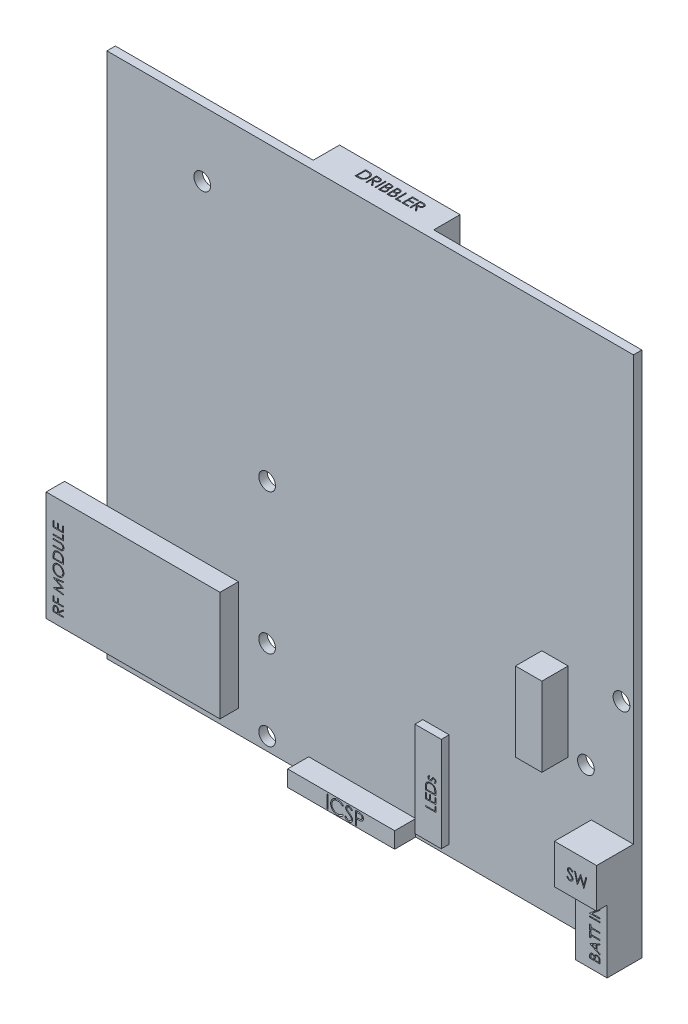
from build123d import *

# Parameters (mm, degrees)
SKETCH1_W            = 100
SKETCH1_H            = 100
BOSS_EXTRUDE1_DEPTH  = 1.6
SKETCH2_W            = 33.025
SKETCH2_H            = 20.825
BOSS_EXTRUDE2_DEPTH  = 3.5
SKETCH3_W            = 32
SKETCH3_H            = 6
BOSS_EXTRUDE3_DEPTH  = 5
SKETCH4_W            = 20.325
SKETCH4_H            = 3.05
BOSS_EXTRUDE4_DEPTH  = 4
SKETCH5_W            = 6
SKETCH5_H            = 12
BOSS_EXTRUDE5_DEPTH  = 5
SKETCH6_W            = 2
SKETCH6_H            = 0.179487179
CUT_EXTRUDE1_DEPTH   = 1
SKETCH8_W            = 0.224358974
SKETCH8_H            = 2.5
CUT_EXTRUDE2_DEPTH   = 1
SKETCH9_W            = 5
SKETCH9_H            = 15
BOSS_EXTRUDE7_DEPTH  = 5
SKETCH11_W           = 22.9
SKETCH11_H           = 6.5
BOSS_EXTRUDE8_DEPTH  = 5
SKETCH12_W           = 0.179487179
SKETCH12_H           = 2
CUT_EXTRUDE3_DEPTH   = 1
SKETCH13_R           = 1.5875
CUT_EXTRUDE5_DEPTH   = 118.655377827
SKETCH14_W           = 5
SKETCH14_H           = 18
BOSS_EXTRUDE9_DEPTH  = 1.5
CUT_EXTRUDE6_DEPTH   = 1
SKETCH16_W           = 8
SKETCH16_H           = 7.5
BOSS_EXTRUDE11_DEPTH = 7
CUT_EXTRUDE7_DEPTH   = 1
CUT_EXTRUDE8_DEPTH   = 1


with BuildPart() as part:
    # Sketch1 → Boss-Extrude1 (new body)
    with BuildSketch(Plane.XY):
        with Locations((24.972274092, -40.434429365)):
            Rectangle(SKETCH1_W, SKETCH1_H)
    extrude(amount=BOSS_EXTRUDE1_DEPTH)

    # Sketch2 → Boss-Extrude2 (add)
    with BuildSketch(Plane.XY.offset(1.6)):
        with Locations((-16.565225908, -75.671929365)):
            Rectangle(SKETCH2_W, SKETCH2_H)
    extrude(amount=BOSS_EXTRUDE2_DEPTH)

    # Sketch3 → Boss-Extrude3 (add)
    with BuildSketch(Plane(origin=(0, 0, 0), x_dir=(-1, 0, 0), z_dir=(0, 0, -1))):
        with Locations((-23.446274092, -40.160429365)):
            Rectangle(SKETCH3_W, SKETCH3_H)
    extrude(amount=BOSS_EXTRUDE3_DEPTH)

    # Sketch4 → Boss-Extrude4 (add)
    with BuildSketch(Plane.XY.offset(1.6)):
        with Locations((23.458774092, -88.909429365)):
            Rectangle(SKETCH4_W, SKETCH4_H)
    extrude(amount=BOSS_EXTRUDE4_DEPTH)

    # Sketch5 → Boss-Extrude5 (add)
    with BuildSketch(Plane.XY.offset(1.6)):
        with Locations((71.972274092, -84.434429365)):
            Rectangle(SKETCH5_W, SKETCH5_H)
    extrude(amount=BOSS_EXTRUDE5_DEPTH)

    # Sketch6 → Cut-Extrude1 (cut)
    # profile 1 of 6: a face of its own
    with BuildSketch(Plane.XY.offset(6.6)):
        with BuildLine():
            Line((71.661934026, -88.819259058), (71.661934026, -88.429034699))
            add(Edge.make_bspline(
                [(71.661934026, -88.429034699), (71.662032874, -88.409932411), (71.662224466, -88.372907421), (71.665264884, -88.319071834), (71.669306834, -88.26862976), (71.676086986, -88.221670335), (71.68311711, -88.177888003), (71.693435649, -88.137727246), (71.704832851, -88.100851668), (71.722368993, -88.056571645), (71.749602843, -88.006329893), (71.78999323, -87.952329409), (71.838418043, -87.905388895), (71.893601937, -87.865475543), (71.954310473, -87.833444229), (72.019237489, -87.810564152), (72.087290664, -87.79586512), (72.133947408, -87.794372419), (72.157526975, -87.793618033)],
                knots=[0, 0, 0, 0, 1.00128172, 1.940733171, 2.826250472, 3.653024905, 4.427672124, 5.149348099, 5.824709082, 6.450061444, 7.643590664, 8.808605388, 9.972104426, 11.165284501, 12.367876273, 13.557044126, 14.765369432, 16, 16, 16, 16], degree=3))
            add(Edge.make_bspline(
                [(72.157526975, -87.793618033), (72.179613179, -87.794246382), (72.223014651, -87.795481147), (72.286384846, -87.807144558), (72.346646197, -87.82565606), (72.403747128, -87.851239701), (72.456624703, -87.884202791), (72.505115119, -87.923697207), (72.547385707, -87.971149432), (72.571008457, -88.00671978), (72.583007744, -88.024787905)],
                knots=[0, 0, 0, 0, 1.044641374, 2.052818814, 3.038628718, 4.023282556, 5.005660861, 5.98021751, 6.974042014, 8, 8, 8, 8], degree=3))
            add(Edge.make_bspline(
                [(72.583007744, -88.024787905), (72.591733425, -88.002069854), (72.608427815, -87.958604596), (72.63789715, -87.898755555), (72.670065746, -87.847379848), (72.704652733, -87.803473877), (72.742483663, -87.766121261), (72.783865897, -87.733771736), (72.828765557, -87.705804941), (72.877017621, -87.682005392), (72.928213035, -87.66331055), (72.981726498, -87.649570099), (73.037352865, -87.641442325), (73.075102032, -87.640333571), (73.094225693, -87.639771879)],
                knots=[0, 0, 0, 0, 1.272586185, 2.434772614, 3.483318042, 4.437947805, 5.351807173, 6.25737843, 7.180033415, 8.1141739, 9.066731021, 10.025721652, 10.999834114, 12, 12, 12, 12], degree=3))
            add(Edge.make_bspline(
                [(73.094225693, -87.639771879), (73.113749699, -87.640329955), (73.152163729, -87.641427984), (73.208594099, -87.649532568), (73.262526811, -87.663245653), (73.314285856, -87.682167015), (73.363762715, -87.70669225), (73.410778149, -87.736970026), (73.455429973, -87.772575302), (73.497796992, -87.81281502), (73.536564146, -87.857659038), (73.569890825, -87.907080031), (73.59854702, -87.959724106), (73.621877871, -88.016264267), (73.639877608, -88.076556179), (73.652418473, -88.140566292), (73.660882668, -88.20818919), (73.661577627, -88.254595102), (73.661934026, -88.278393674)],
                knots=[0, 0, 0, 0, 0.978680899, 1.925582087, 2.851223405, 3.764209995, 4.683484765, 5.614004905, 6.562443559, 7.542772147, 8.539900013, 9.527881485, 10.525548727, 11.540192123, 12.58875426, 13.674701727, 14.807505862, 16, 16, 16, 16], degree=3))
            Line((73.661934026, -88.278393674), (73.661934026, -88.819259058))
            Line((73.661934026, -88.819259058), (71.661934026, -88.819259058))
        make_face()
        with BuildLine():
            Line((71.867062231, -88.639771879), (72.508087872, -88.639771879))
            Line((72.508087872, -88.639771879), (72.508087872, -88.51917893))
            add(Edge.make_bspline(
                [(72.508087872, -88.51917893), (72.507859345, -88.501551047), (72.507417784, -88.467490385), (72.506152916, -88.41816473), (72.502611179, -88.372379004), (72.499070452, -88.330212248), (72.493313561, -88.291730832), (72.486460866, -88.257020116), (72.479213665, -88.225535002), (72.466887513, -88.189227541), (72.448676656, -88.148037231), (72.420387453, -88.104155384), (72.38671973, -88.065290347), (72.347508463, -88.032864574), (72.304800497, -88.006092257), (72.25897077, -87.987337408), (72.210941545, -87.974834108), (72.177905753, -87.973687414), (72.161132744, -87.973105212)],
                knots=[0, 0, 0, 0, 1.156917035, 2.235399477, 3.236897345, 4.169954739, 5.01148057, 5.788325709, 6.491867502, 7.129259015, 8.302032419, 9.437271567, 10.542795419, 11.662606952, 12.764338259, 13.836858145, 14.901724648, 16, 16, 16, 16], degree=3))
            add(Edge.make_bspline(
                [(72.161132744, -87.973105212), (72.150030848, -87.973400819), (72.128253267, -87.973980683), (72.096403442, -87.978902296), (72.066476289, -87.986876616), (72.038184583, -87.997675995), (72.012231439, -88.012429549), (71.987376751, -88.029530857), (71.965109191, -88.050644849), (71.944356713, -88.074505535), (71.925783315, -88.101806416), (71.910398133, -88.133135689), (71.896454047, -88.167683445), (71.886131654, -88.206386984), (71.877054728, -88.248444354), (71.871351635, -88.294425029), (71.86768164, -88.344037639), (71.867273306, -88.378412946), (71.867062231, -88.396182135)],
                knots=[0, 0, 0, 0, 0.911708768, 1.788416306, 2.640049961, 3.452993646, 4.268229297, 5.087074648, 5.92553149, 6.781184137, 7.681934069, 8.628939405, 9.643570426, 10.73771997, 11.914765019, 13.176320755, 14.540391495, 16, 16, 16, 16], degree=3))
            Line((71.867062231, -88.396182135), (71.867062231, -88.639771879))
        make_face(mode=Mode.SUBTRACT)
        with BuildLine():
            Line((72.713216078, -88.639771879), (73.456805821, -88.639771879))
            Line((73.456805821, -88.639771879), (73.456805821, -88.384162905))
            add(Edge.make_bspline(
                [(73.456805821, -88.384162905), (73.456564733, -88.365868289), (73.456100066, -88.33060783), (73.455010328, -88.279657692), (73.450888011, -88.23255802), (73.447085192, -88.189160232), (73.440582536, -88.149579505), (73.434445719, -88.113511381), (73.425336053, -88.081547945), (73.412815888, -88.044143329), (73.392772659, -88.002333614), (73.36348969, -87.956643122), (73.327349986, -87.916801721), (73.286247916, -87.882601597), (73.241680731, -87.85437817), (73.194231059, -87.834125191), (73.144821708, -87.821539268), (73.111124983, -87.820020658), (73.094225693, -87.819259058)],
                knots=[0, 0, 0, 0, 1.160376723, 2.23647316, 3.230273494, 4.158083346, 4.997711197, 5.773399541, 6.476071462, 7.102777513, 8.27340052, 9.405620712, 10.53304798, 11.669441455, 12.787990954, 13.865552736, 14.929550474, 16, 16, 16, 16], degree=3))
            add(Edge.make_bspline(
                [(73.094225693, -87.819259058), (73.083657842, -87.819416349), (73.062692601, -87.819728394), (73.03188688, -87.824455789), (73.002031264, -87.831294832), (72.973001341, -87.840302049), (72.945285211, -87.852893652), (72.918776582, -87.868329903), (72.892941446, -87.885999434), (72.859857317, -87.913260178), (72.822212166, -87.953490083), (72.785810507, -88.010661266), (72.7559797, -88.075308004), (72.743368512, -88.122305226), (72.736853898, -88.146582776)],
                knots=[0, 0, 0, 0, 0.723302347, 1.434937762, 2.129609326, 2.821140842, 3.513216847, 4.209993937, 4.920569932, 5.655069131, 7.14393391, 8.6716197, 10.280644748, 12, 12, 12, 12], degree=3))
            add(Edge.make_bspline(
                [(72.736853898, -88.146582776), (72.734879564, -88.156313688), (72.730598802, -88.177412313), (72.726080114, -88.211816644), (72.722054366, -88.251094284), (72.719076561, -88.295335928), (72.715998536, -88.344597551), (72.714801496, -88.398984362), (72.713373347, -88.458274256), (72.713269842, -88.499412754), (72.713216078, -88.520781494)],
                knots=[0, 0, 0, 0, 0.634451884, 1.375622551, 2.216452059, 3.157844607, 4.20941857, 5.370758133, 6.634282058, 8, 8, 8, 8], degree=3))
            Line((72.713216078, -88.520781494), (72.713216078, -88.639771879))
        make_face(mode=Mode.SUBTRACT)
    # profile 2 of 6: a face of its own
    with BuildSketch(Plane.XY.offset(6.6)):
        Polygon((71.661934026, -86.409002648), (73.661934026, -85.485925725), (73.661934026, -85.681037905), (73.020908385, -85.976710982), (73.020908385, -86.883361623), (73.661934026, -87.187448161), (73.661934026, -87.383361623), (71.661934026, -86.434643674), align=None)
        Polygon((72.051757744, -86.423826366), (72.81578018, -86.786005853), (72.81578018, -86.071262264), align=None, mode=Mode.SUBTRACT)
    # profile 3 of 6: a face of its own
    with BuildSketch(Plane.XY.offset(6.6)):
        Polygon((71.867062231, -85.409002648), (71.661934026, -85.409002648), (71.661934026, -84.357720597), (71.867062231, -84.357720597), (71.867062231, -84.793618033), (73.661934026, -84.793618033), (73.661934026, -84.973105212), (71.867062231, -84.973105212), align=None)
    # profile 4 of 6: a face of its own
    with BuildSketch(Plane.XY.offset(6.6)):
        Polygon((71.867062231, -84.229515469), (71.661934026, -84.229515469), (71.661934026, -83.178233417), (71.867062231, -83.178233417), (71.867062231, -83.614130853), (73.661934026, -83.614130853), (73.661934026, -83.793618033), (71.867062231, -83.793618033), align=None)
    # profile 5 of 6: a face of its own
    with BuildSketch(Plane.XY.offset(6.6)):
        with Locations((72.661934026, -81.9602847)):
            Rectangle(SKETCH6_W, SKETCH6_H)
    # profile 6 of 6: a face of its own
    with BuildSketch(Plane.XY.offset(6.6)):
        Polygon((73.661934026, -81.434643674), (71.661934026, -81.434643674), (71.661934026, -81.396983417), (73.236052616, -80.075669315), (71.661934026, -80.075669315), (71.661934026, -79.896182135), (73.661934026, -79.896182135), (73.661934026, -79.93704752), (72.091421206, -81.255156494), (73.661934026, -81.255156494), align=None)
    extrude(amount=-CUT_EXTRUDE1_DEPTH, mode=Mode.SUBTRACT)

    # Sketch8 → Cut-Extrude2 (cut)
    # profile 1 of 4: a face of its own
    with BuildSketch(Plane.XY.offset(5.6)):
        with Locations((20.834362739, -88.966417167)):
            Rectangle(SKETCH8_W, SKETCH8_H)
    # profile 2 of 4: a face of its own
    with BuildSketch(Plane.XY.offset(5.6)):
        with BuildLine():
            Line((23.895260175, -88.175151141), (23.698946073, -88.325391526))
            add(Edge.make_bspline(
                [(23.698946073, -88.325391526), (23.684941867, -88.308701547), (23.657122262, -88.275546608), (23.612365688, -88.22898979), (23.565721658, -88.185371746), (23.517208, -88.144484689), (23.465951486, -88.107758428), (23.413193773, -88.073279069), (23.358052312, -88.042373542), (23.281801073, -88.00489998), (23.18205261, -87.965795584), (23.056484867, -87.933007561), (22.925405511, -87.912135293), (22.835978654, -87.909874692), (22.790492547, -87.908724859)],
                knots=[0, 0, 0, 0, 0.757959112, 1.505699292, 2.245454638, 2.979532153, 3.711538275, 4.438200793, 5.171680507, 5.909471876, 7.393775596, 8.890124382, 10.418191784, 12, 12, 12, 12], degree=3))
            add(Edge.make_bspline(
                [(22.790492547, -87.908724859), (22.765433047, -87.909013404), (22.715546624, -87.909587815), (22.641512, -87.917165762), (22.568859821, -87.927816626), (22.497637345, -87.943620428), (22.427935232, -87.96360087), (22.359297802, -87.987476166), (22.292718802, -88.017015337), (22.227277203, -88.049664095), (22.164577767, -88.086540841), (22.105252732, -88.126764664), (22.04951847, -88.169885447), (21.99733089, -88.216064808), (21.948636641, -88.26509478), (21.903788562, -88.317497881), (21.86294184, -88.373106577), (21.825286822, -88.431187582), (21.791563441, -88.491571719), (21.763327813, -88.554482484), (21.738324154, -88.618842557), (21.718538981, -88.685379101), (21.702878612, -88.753623933), (21.692073138, -88.823760211), (21.684581373, -88.89564141), (21.684009818, -88.944362348), (21.683721714, -88.968921173)],
                knots=[0, 0, 0, 0, 1.054917814, 2.100044995, 3.131103042, 4.146048494, 5.169673617, 6.183595914, 7.203665975, 8.234915748, 9.262203917, 10.264457458, 11.251630812, 12.227803204, 13.197192746, 14.159520551, 15.12972552, 16.100847026, 17.073214652, 18.039054194, 19.002613845, 19.979014051, 20.95965708, 21.949030935, 22.966165397, 24, 24, 24, 24], degree=3))
            add(Edge.make_bspline(
                [(21.683721714, -88.968921173), (21.684623013, -89.005872116), (21.686392594, -89.078420391), (21.702141405, -89.184685113), (21.726073613, -89.286485594), (21.761941882, -89.383185481), (21.806169775, -89.475977166), (21.862055926, -89.563290632), (21.926782024, -89.646445321), (22.001263752, -89.723475998), (22.082982192, -89.793842945), (22.170659272, -89.855807646), (22.264076621, -89.907461134), (22.362202785, -89.950443952), (22.465792866, -89.983484472), (22.574660582, -90.00674456), (22.68856915, -90.021917547), (22.766404436, -90.023370181), (22.806017387, -90.024109475)],
                knots=[0, 0, 0, 0, 1.029171465, 2.020641659, 2.987623507, 3.938342917, 4.889210282, 5.84687017, 6.821220943, 7.821438502, 8.827599549, 9.822697543, 10.807740252, 11.797342354, 12.80366471, 13.83203677, 14.896651826, 16, 16, 16, 16], degree=3))
            add(Edge.make_bspline(
                [(22.806017387, -90.024109475), (22.849662164, -90.022903203), (22.935565528, -90.020528973), (23.06154269, -90.000415223), (23.182139665, -89.967802425), (23.297362941, -89.922161052), (23.406887689, -89.862828703), (23.510885303, -89.790901648), (23.609443568, -89.705695696), (23.668708769, -89.640636319), (23.698946073, -89.607442808)],
                knots=[0, 0, 0, 0, 1.028121516, 2.023589091, 2.998037872, 3.967518031, 4.937445131, 5.927275754, 6.942489185, 8, 8, 8, 8], degree=3))
            Line((23.698946073, -89.607442808), (23.895260175, -89.756180789))
            add(Edge.make_bspline(
                [(23.895260175, -89.756180789), (23.879461525, -89.776565397), (23.8479399, -89.817236973), (23.796898459, -89.874573909), (23.743128961, -89.928505362), (23.686232025, -89.97859652), (23.626862174, -90.02584971), (23.56395338, -90.068922447), (23.498332642, -90.108415936), (23.4302223, -90.144578025), (23.35969472, -90.176661772), (23.286834409, -90.204128749), (23.211955426, -90.227789385), (23.135054349, -90.247255054), (23.055971666, -90.262448685), (22.974992755, -90.272605596), (22.891942845, -90.279564106), (22.835913258, -90.280198332), (22.80751979, -90.280519731)],
                knots=[0, 0, 0, 0, 0.986787822, 1.968848986, 2.935600012, 3.899624008, 4.868462664, 5.837806735, 6.815139263, 7.798259679, 8.787526145, 9.778297419, 10.776456485, 11.791383307, 12.812564526, 13.85620153, 14.913611965, 16, 16, 16, 16], degree=3))
            add(Edge.make_bspline(
                [(22.80751979, -90.280519731), (22.780631457, -90.280332593), (22.727463107, -90.279962552), (22.648963998, -90.273968147), (22.572542869, -90.265789763), (22.498418137, -90.253475384), (22.426185297, -90.238943712), (22.356499165, -90.219464243), (22.288674015, -90.19764341), (22.222982343, -90.171996991), (22.159368272, -90.143056861), (22.098036978, -90.110348604), (22.039016669, -90.074147272), (21.981727083, -90.035250836), (21.927014523, -89.992409906), (21.874404862, -89.946219453), (21.823603094, -89.89683516), (21.792172604, -89.86122455), (21.776369951, -89.843320212)],
                knots=[0, 0, 0, 0, 1.114604814, 2.203992996, 3.262667896, 4.300477797, 5.318619304, 6.316056647, 7.298880507, 8.271930387, 9.238335007, 10.195173496, 11.151986948, 12.108099108, 13.064862484, 14.031167946, 15.010108607, 16, 16, 16, 16], degree=3))
            add(Edge.make_bspline(
                [(21.776369951, -89.843320212), (21.751058777, -89.812219362), (21.700742008, -89.750393141), (21.636366519, -89.650188868), (21.581261123, -89.545568719), (21.536706894, -89.435983056), (21.50187637, -89.321677779), (21.477746945, -89.202595269), (21.462067227, -89.078846739), (21.460274164, -88.994677604), (21.459362739, -88.95189393)],
                knots=[0, 0, 0, 0, 0.994628077, 1.977248131, 2.950237994, 3.925870899, 4.908910175, 5.911660606, 6.938484602, 8, 8, 8, 8], degree=3))
            add(Edge.make_bspline(
                [(21.459362739, -88.95189393), (21.460473592, -88.906925749), (21.462659125, -88.81845366), (21.48122755, -88.688615121), (21.511098119, -88.564221265), (21.553524468, -88.445504305), (21.607314004, -88.331839819), (21.673761586, -88.224096101), (21.752095259, -88.121584101), (21.841700664, -88.025859279), (21.939963047, -87.93833117), (22.045190771, -87.861326739), (22.157177876, -87.797242799), (22.274690627, -87.743674111), (22.398608971, -87.702499495), (22.52866852, -87.67367579), (22.664624888, -87.655734993), (22.757383764, -87.653466987), (22.804514983, -87.652314603)],
                knots=[0, 0, 0, 0, 1.032925535, 2.032216505, 3.007276963, 3.968222605, 4.92396291, 5.891752235, 6.871517503, 7.883894988, 8.900124299, 9.891468569, 10.874487609, 11.85992873, 12.854644235, 13.869047385, 14.917252991, 16, 16, 16, 16], degree=3))
            add(Edge.make_bspline(
                [(22.804514983, -87.652314603), (22.833239606, -87.652658987), (22.890097104, -87.653340661), (22.974206141, -87.659987906), (23.056093517, -87.671069053), (23.135815648, -87.68615196), (23.213760373, -87.704871475), (23.289331974, -87.729257403), (23.362973893, -87.757140639), (23.434221685, -87.789253829), (23.502733506, -87.825301502), (23.568488019, -87.86488409), (23.630962919, -87.907952523), (23.69059781, -87.954140505), (23.746395104, -88.00442519), (23.799939017, -88.057423473), (23.849411216, -88.114661919), (23.879949212, -88.154951157), (23.895260175, -88.175151141)],
                knots=[0, 0, 0, 0, 1.096760587, 2.17092713, 3.219439832, 4.250915756, 5.268269357, 6.278326846, 7.281116186, 8.274029601, 9.260640565, 10.235837813, 11.203064059, 12.156899882, 13.114053108, 14.069676657, 15.032185724, 16, 16, 16, 16], degree=3))
        make_face()
    # profile 3 of 4: a face of its own
    with BuildSketch(Plane.XY.offset(5.6)):
        with BuildLine():
            Line((24.151670431, -89.734145532), (24.363008573, -89.607442808))
            add(Edge.make_bspline(
                [(24.363008573, -89.607442808), (24.382664456, -89.64034594), (24.420324371, -89.703387071), (24.48314677, -89.788571386), (24.548241707, -89.860972926), (24.616091231, -89.920170503), (24.686281194, -89.966776851), (24.759269804, -89.999778445), (24.834811097, -90.020361285), (24.88622097, -90.022861346), (24.911886778, -90.024109475)],
                knots=[0, 0, 0, 0, 1.272034388, 2.437168799, 3.508375237, 4.49857839, 5.41946034, 6.295179144, 7.148887113, 8, 8, 8, 8], degree=3))
            add(Edge.make_bspline(
                [(24.911886778, -90.024109475), (24.933805964, -90.023498994), (24.977260802, -90.022288715), (25.041233832, -90.010659571), (25.103363691, -89.992793765), (25.162369861, -89.967207385), (25.217438157, -89.936251324), (25.265728654, -89.898861197), (25.307475877, -89.856999622), (25.341625245, -89.810297725), (25.36782527, -89.760071191), (25.387962462, -89.70851694), (25.399137514, -89.654825105), (25.40082091, -89.618674775), (25.401670431, -89.60043159)],
                knots=[0, 0, 0, 0, 1.095163259, 2.171163733, 3.241058638, 4.321873601, 5.38011039, 6.391990106, 7.366004449, 8.327778327, 9.272591725, 10.192022065, 11.087607919, 12, 12, 12, 12], degree=3))
            add(Edge.make_bspline(
                [(25.401670431, -89.60043159), (25.400617352, -89.579616697), (25.398476597, -89.537303062), (25.380382682, -89.474874739), (25.351918934, -89.413094331), (25.325659903, -89.374879142), (25.312027002, -89.355038962)],
                knots=[0, 0, 0, 0, 0.938893495, 1.908633276, 2.914225137, 4, 4, 4, 4], degree=3))
            add(Edge.make_bspline(
                [(25.312027002, -89.355038962), (25.300833706, -89.340719802), (25.277334782, -89.310658517), (25.236936558, -89.265911921), (25.189532191, -89.219755907), (25.136743938, -89.170428009), (25.076648874, -89.12022244), (25.011129221, -89.066745099), (24.938512179, -89.012029687), (24.887583967, -88.975334997), (24.861305848, -88.956401141)],
                knots=[0, 0, 0, 0, 0.722233717, 1.516239348, 2.393582979, 3.351407094, 4.387010283, 5.505090956, 6.712668013, 8, 8, 8, 8], degree=3))
            add(Edge.make_bspline(
                [(24.861305848, -88.956401141), (24.835002994, -88.937666436), (24.784713939, -88.901847106), (24.71438638, -88.848686903), (24.651497478, -88.800084139), (24.596326752, -88.755581273), (24.548898469, -88.71517227), (24.508838889, -88.67924517), (24.477168491, -88.646828341), (24.459557362, -88.625798811), (24.451650399, -88.616357071)],
                knots=[0, 0, 0, 0, 1.452282411, 2.77665338, 3.964542531, 5.026858415, 5.96415736, 6.766646006, 7.446254459, 8, 8, 8, 8], degree=3))
            add(Edge.make_bspline(
                [(24.451650399, -88.616357071), (24.440598581, -88.601642044), (24.418863698, -88.57270297), (24.390173694, -88.527470929), (24.365788578, -88.481168597), (24.346672626, -88.43367155), (24.330575327, -88.385646601), (24.319748234, -88.33646714), (24.312968665, -88.286353841), (24.312274388, -88.252629912), (24.311926842, -88.235748096)],
                knots=[0, 0, 0, 0, 1.068054152, 2.10047183, 3.106115577, 4.101338837, 5.06977816, 6.043150881, 7.020423561, 8, 8, 8, 8], degree=3))
            add(Edge.make_bspline(
                [(24.311926842, -88.235748096), (24.312859134, -88.209298257), (24.314703791, -88.156963926), (24.330304161, -88.080513333), (24.354927656, -88.007523035), (24.389424004, -87.938715654), (24.433893542, -87.87588281), (24.485354953, -87.818301748), (24.546648871, -87.769895618), (24.613900745, -87.72760129), (24.687512439, -87.694497058), (24.764648799, -87.669524929), (24.845432422, -87.65537546), (24.900148947, -87.653344913), (24.927912419, -87.652314603)],
                knots=[0, 0, 0, 0, 1.005424448, 1.989358655, 2.955360095, 3.929531133, 4.905563448, 5.876582895, 6.856512386, 7.866279853, 8.892233794, 9.918561126, 10.94386622, 12, 12, 12, 12], degree=3))
            add(Edge.make_bspline(
                [(24.927912419, -87.652314603), (24.95737249, -87.653330711), (25.01595917, -87.655351426), (25.102137181, -87.672921091), (25.185109122, -87.701993), (25.251854311, -87.734984898), (25.304091997, -87.767935909), (25.343929664, -87.79795007), (25.384299271, -87.832503719), (25.425526453, -87.871688894), (25.466912639, -87.915865145), (25.509072247, -87.964729923), (25.552103868, -88.017984606), (25.579786625, -88.056002106), (25.593978124, -88.075491686)],
                knots=[0, 0, 0, 0, 1.286793592, 2.559021753, 3.825965368, 5.121522368, 5.803751409, 6.523245864, 7.299691795, 8.125521123, 9.008227632, 9.944561021, 10.946284179, 12, 12, 12, 12], degree=3))
            Line((25.593978124, -88.075491686), (25.391153605, -88.22923768))
            add(Edge.make_bspline(
                [(25.391153605, -88.22923768), (25.37890651, -88.213460044), (25.355321469, -88.183076006), (25.319514693, -88.140525066), (25.285765659, -88.101656152), (25.252515373, -88.067895346), (25.221519922, -88.037393822), (25.19143632, -88.01127971), (25.162697498, -87.989297142), (25.126471133, -87.965837457), (25.080958477, -87.942582811), (25.023826666, -87.922904898), (24.964122184, -87.911079854), (24.923458161, -87.909516363), (24.902872355, -87.908724859)],
                knots=[0, 0, 0, 0, 1.181633172, 2.275549214, 3.290209073, 4.226197932, 5.078386478, 5.862611352, 6.581680152, 7.217281963, 8.414376989, 9.595101626, 10.782541182, 12, 12, 12, 12], degree=3))
            add(Edge.make_bspline(
                [(24.902872355, -87.908724859), (24.877046267, -87.909590359), (24.82724309, -87.911259394), (24.756535779, -87.929487955), (24.692897261, -87.958189284), (24.638216857, -87.998414268), (24.592690445, -88.04607212), (24.559757975, -88.10091416), (24.539936429, -88.161473019), (24.537517657, -88.203717059), (24.536285816, -88.225231269)],
                knots=[0, 0, 0, 0, 1.14458467, 2.207223713, 3.21896685, 4.227309161, 5.202851033, 6.127160689, 7.046193047, 8, 8, 8, 8], degree=3))
            add(Edge.make_bspline(
                [(24.536285816, -88.225231269), (24.536566621, -88.238625183), (24.53712869, -88.265434911), (24.544967831, -88.305043069), (24.55503878, -88.344551169), (24.570997803, -88.383781585), (24.593030162, -88.423420413), (24.621962431, -88.464150226), (24.658400511, -88.506330018), (24.686312663, -88.533763856), (24.701049438, -88.548248096)],
                knots=[0, 0, 0, 0, 0.858281714, 1.717966888, 2.583508476, 3.4729293, 4.427298488, 5.488583878, 6.674047936, 8, 8, 8, 8], degree=3))
            add(Edge.make_bspline(
                [(24.701049438, -88.548248096), (24.706521847, -88.553131686), (24.719523038, -88.564733978), (24.743291556, -88.583728464), (24.774679269, -88.607159016), (24.812866556, -88.636149956), (24.858557528, -88.669779572), (24.911757211, -88.707617866), (24.971872592, -88.750893194), (25.014531103, -88.78114858), (25.037087098, -88.797146333)],
                knots=[0, 0, 0, 0, 0.420754252, 0.999615792, 1.744751191, 2.668019286, 3.750313428, 4.999500688, 6.413464383, 8, 8, 8, 8], degree=3))
            add(Edge.make_bspline(
                [(25.037087098, -88.797146333), (25.064219893, -88.816890162), (25.116758791, -88.855121349), (25.191514205, -88.91256112), (25.259295497, -88.968738098), (25.320340642, -89.023293531), (25.375252719, -89.075813598), (25.42342252, -89.126930155), (25.465340863, -89.176276993), (25.510468876, -89.239543118), (25.556581604, -89.317243893), (25.596182681, -89.412442635), (25.621152929, -89.508011435), (25.624418297, -89.57224489), (25.626029406, -89.603937199)],
                knots=[0, 0, 0, 0, 1.163667725, 2.253281268, 3.268753668, 4.215851969, 5.092017293, 5.902905408, 6.650798638, 7.335211899, 8.59617414, 9.77448103, 10.901945474, 12, 12, 12, 12], degree=3))
            add(Edge.make_bspline(
                [(25.626029406, -89.603937199), (25.625560021, -89.626350317), (25.624630368, -89.670741305), (25.613944001, -89.735923503), (25.598287097, -89.799231267), (25.574689073, -89.859882061), (25.545886817, -89.918985463), (25.509339497, -89.974991107), (25.466976865, -90.029138534), (25.418381319, -90.079983885), (25.365205674, -90.126659739), (25.309003035, -90.168180498), (25.249681412, -90.202800729), (25.187562614, -90.23105133), (25.122632374, -90.2531467), (25.054912528, -90.269155892), (24.984291449, -90.2789814), (24.936291105, -90.280001229), (24.911886778, -90.280519731)],
                knots=[0, 0, 0, 0, 0.983748083, 1.948392443, 2.894712957, 3.844097841, 4.80183111, 5.778335162, 6.776009319, 7.81870978, 8.863265674, 9.881300176, 10.883814829, 11.87499822, 12.874611388, 13.892143829, 14.928324115, 16, 16, 16, 16], degree=3))
            add(Edge.make_bspline(
                [(24.911886778, -90.280519731), (24.89300439, -90.280154601), (24.855477418, -90.27942894), (24.799970646, -90.27301374), (24.745585225, -90.263937237), (24.693003595, -90.249527187), (24.641548301, -90.232043632), (24.591443133, -90.210516252), (24.542663809, -90.184718251), (24.494936964, -90.155221805), (24.448383982, -90.120894844), (24.403441505, -90.080913775), (24.358634944, -90.036381272), (24.315286804, -89.986088012), (24.272520272, -89.930846525), (24.231178551, -89.870139965), (24.190405896, -89.804298998), (24.164823419, -89.757966794), (24.151670431, -89.734145532)],
                knots=[0, 0, 0, 0, 0.915332311, 1.819136955, 2.706846663, 3.586547465, 4.459518054, 5.340707479, 6.227863349, 7.133153174, 8.059268498, 9.028702269, 10.047606654, 11.120612155, 12.245963614, 13.433783089, 14.680604001, 16, 16, 16, 16], degree=3))
        make_face()
    # profile 4 of 4: a face of its own
    with BuildSketch(Plane.XY.offset(5.6)):
        with BuildLine():
            Line((26.138849919, -87.716417167), (26.629134374, -87.716417167))
            add(Edge.make_bspline(
                [(26.629134374, -87.716417167), (26.66285645, -87.716454236), (26.727469444, -87.716525261), (26.820123056, -87.718678651), (26.904272864, -87.721554859), (26.979737422, -87.725541926), (27.04674892, -87.730253776), (27.105004134, -87.736862376), (27.15496096, -87.743762587), (27.184894139, -87.750777877), (27.198545431, -87.753977263)],
                knots=[0, 0, 0, 0, 1.415646017, 2.712440637, 3.8905458, 4.950247383, 5.884950622, 6.709939814, 7.411656543, 8, 8, 8, 8], degree=3))
            add(Edge.make_bspline(
                [(27.198545431, -87.753977263), (27.215826527, -87.758707227), (27.249981511, -87.7680557), (27.299196542, -87.786779788), (27.346020717, -87.808981335), (27.390614687, -87.834284149), (27.432430461, -87.863773837), (27.472091919, -87.896254993), (27.509249047, -87.932477542), (27.543692899, -87.972035213), (27.575324897, -88.014263935), (27.602560385, -88.059794099), (27.625365547, -88.107859316), (27.644925027, -88.158426152), (27.659002494, -88.21191924), (27.669607422, -88.267966892), (27.676338585, -88.326563099), (27.676983272, -88.366605862), (27.677311457, -88.386990083)],
                knots=[0, 0, 0, 0, 0.999701418, 1.975846123, 2.934577507, 3.890451536, 4.834027766, 5.787354733, 6.749476667, 7.726910423, 8.712836071, 9.690891519, 10.682875813, 11.679750201, 12.712814741, 13.765529915, 14.8625177, 16, 16, 16, 16], degree=3))
            add(Edge.make_bspline(
                [(27.677311457, -88.386990083), (27.677010439, -88.407545638), (27.676421478, -88.44776397), (27.669352703, -88.506601676), (27.659831137, -88.562829097), (27.645190386, -88.616321562), (27.626014905, -88.666761398), (27.603520581, -88.714919421), (27.576389488, -88.759976329), (27.54521461, -88.802095699), (27.5105349, -88.841317065), (27.472497087, -88.877356204), (27.431254735, -88.91000216), (27.386938915, -88.939328119), (27.339117594, -88.964654033), (27.288516056, -88.987337823), (27.234694473, -89.00638858), (27.19744982, -89.016410053), (27.17851338, -89.021505308)],
                knots=[0, 0, 0, 0, 1.121902311, 2.195077645, 3.232258892, 4.234102512, 5.217864754, 6.176164875, 7.132989551, 8.084763148, 9.034132444, 9.988522005, 10.94243251, 11.903244335, 12.886203696, 13.894208494, 14.929344452, 16, 16, 16, 16], degree=3))
            add(Edge.make_bspline(
                [(27.17851338, -89.021505308), (27.162850999, -89.024836009), (27.128525979, -89.032135433), (27.071995463, -89.040284331), (27.006177331, -89.04723976), (26.931161416, -89.052454858), (26.847015056, -89.056919407), (26.753692729, -89.060468045), (26.651011245, -89.062417941), (26.579388928, -89.062518507), (26.541994951, -89.062571013)],
                knots=[0, 0, 0, 0, 0.601384939, 1.31797006, 2.144135048, 3.087295005, 4.142315834, 5.309527816, 6.595305764, 8, 8, 8, 8], degree=3))
            Line((26.541994951, -89.062571013), (26.363208893, -89.062571013))
            Line((26.363208893, -89.062571013), (26.363208893, -90.216417167))
            Line((26.363208893, -90.216417167), (26.138849919, -90.216417167))
            Line((26.138849919, -90.216417167), (26.138849919, -87.716417167))
        make_face()
        with BuildLine():
            Line((26.363208893, -87.972827423), (26.363208893, -88.806160757))
            Line((26.363208893, -88.806160757), (26.800909214, -88.811669571))
            add(Edge.make_bspline(
                [(26.800909214, -88.811669571), (26.822280589, -88.811680616), (26.863537589, -88.811701939), (26.923134891, -88.808855351), (26.978427239, -88.805569256), (27.029244793, -88.800757882), (27.075610461, -88.793956984), (27.117601553, -88.787091457), (27.154892469, -88.777159055), (27.198534756, -88.763785434), (27.247165719, -88.740976423), (27.30007111, -88.707869359), (27.344907244, -88.665668853), (27.383706027, -88.618220402), (27.41449594, -88.565435309), (27.437035934, -88.508957498), (27.450279618, -88.449366176), (27.452055471, -88.408588934), (27.452952483, -88.387991686)],
                knots=[0, 0, 0, 0, 1.160613943, 2.240541288, 3.23993089, 4.169200891, 5.011653406, 5.7853311, 6.478053781, 7.106038997, 8.262395093, 9.384106736, 10.481365981, 11.59014053, 12.70357646, 13.786202915, 14.881775077, 16, 16, 16, 16], degree=3))
            add(Edge.make_bspline(
                [(27.452952483, -88.387991686), (27.452050592, -88.367892748), (27.450257746, -88.327938546), (27.436932129, -88.269382289), (27.414539762, -88.213499643), (27.383499338, -88.16137601), (27.345827102, -88.114098293), (27.302041857, -88.073028917), (27.25224667, -88.040013415), (27.205926505, -88.018703928), (27.164782801, -88.005693017), (27.129045687, -87.996589559), (27.088695205, -87.989321269), (27.04371822, -87.98343591), (26.994463338, -87.978397724), (26.940507399, -87.974979168), (26.882054797, -87.972978128), (26.841475818, -87.972878874), (26.820440464, -87.972827423)],
                knots=[0, 0, 0, 0, 1.120700087, 2.227813068, 3.331159281, 4.466773991, 5.599788987, 6.693661531, 7.80175334, 8.91857717, 9.525282508, 10.207424825, 10.974604443, 11.810962634, 12.737642355, 13.736264703, 14.826523623, 16, 16, 16, 16], degree=3))
            Line((26.820440464, -87.972827423), (26.363208893, -87.972827423))
        make_face(mode=Mode.SUBTRACT)
    extrude(amount=-CUT_EXTRUDE2_DEPTH, mode=Mode.SUBTRACT)

    # Sketch9 → Boss-Extrude7 (add)
    with BuildSketch(Plane.XY.offset(1.6)):
        with Locations((60.072274092, -55.309429365)):
            Rectangle(SKETCH9_W, SKETCH9_H)
    extrude(amount=BOSS_EXTRUDE7_DEPTH)

    # Sketch11 → Boss-Extrude8 (add)
    with BuildSketch(Plane(origin=(0, 0, 0), x_dir=(-1, 0, 0), z_dir=(0, 0, -1))):
        with Locations((-23.996274092, 6.315570635)):
            Rectangle(SKETCH11_W, SKETCH11_H)
    extrude(amount=BOSS_EXTRUDE8_DEPTH)

    # Sketch12 → Cut-Extrude3 (cut)
    # profile 1 of 8: a face of its own
    with BuildSketch(Plane(origin=(0, 9.565570635, 0), x_dir=(1, 0, 0), z_dir=(0, 1, 0))):
        with BuildLine():
            Line((19.092225151, 1.411527056), (19.092225151, 3.411527056))
            Line((19.092225151, 3.411527056), (19.496071305, 3.411527056))
            add(Edge.make_bspline(
                [(19.496071305, 3.411527056), (19.531196441, 3.411274159), (19.599058021, 3.410785563), (19.697122277, 3.407687626), (19.787855856, 3.402207359), (19.870960347, 3.394224773), (19.946663896, 3.38442304), (20.014754529, 3.372137094), (20.075584325, 3.357629568), (20.112995434, 3.34526074), (20.13068669, 3.339411672)],
                knots=[0, 0, 0, 0, 1.314313732, 2.53924729, 3.670748893, 4.714932338, 5.66265055, 6.526160246, 7.303039223, 8, 8, 8, 8], degree=3))
            add(Edge.make_bspline(
                [(20.13068669, 3.339411672), (20.153826541, 3.330594126), (20.199581508, 3.313158986), (20.264728435, 3.280269671), (20.326057214, 3.243005042), (20.383896725, 3.201315977), (20.436925769, 3.154022064), (20.487215995, 3.103132301), (20.532710123, 3.046796106), (20.574372007, 2.986181827), (20.611935241, 2.922003512), (20.644586188, 2.85438345), (20.671702756, 2.783665045), (20.694213171, 2.710044961), (20.711954004, 2.633361316), (20.724057965, 2.553524821), (20.732041388, 2.470850999), (20.732843703, 2.414751305), (20.733250792, 2.386286672)],
                knots=[0, 0, 0, 0, 0.984719456, 1.947108742, 2.898477687, 3.838006223, 4.779231079, 5.722358779, 6.681677486, 7.655904652, 8.64651281, 9.637519902, 10.640069247, 11.656948941, 12.698408672, 13.768548281, 14.867775369, 16, 16, 16, 16], degree=3))
            add(Edge.make_bspline(
                [(20.733250792, 2.386286672), (20.732891382, 2.361565964), (20.732183127, 2.312851228), (20.725823518, 2.24105643), (20.716579907, 2.171391532), (20.702268937, 2.104188275), (20.684896072, 2.038857865), (20.662630843, 1.976096582), (20.637124845, 1.915328691), (20.607382057, 1.857375848), (20.574729837, 1.802471064), (20.539688841, 1.750713619), (20.502296443, 1.702842064), (20.462196082, 1.658711428), (20.419905958, 1.618388241), (20.375149198, 1.58153566), (20.327810312, 1.548874772), (20.278101327, 1.519122139), (20.224572111, 1.49316765), (20.166208758, 1.471207644), (20.102762371, 1.453009578), (20.034388681, 1.437826209), (19.960969551, 1.425782036), (19.882432999, 1.417709812), (19.798899691, 1.412250993), (19.741540111, 1.411773054), (19.712016818, 1.411527056)],
                knots=[0, 0, 0, 0, 1.105936401, 2.179363191, 3.223086493, 4.248585256, 5.251745608, 6.245858792, 7.225916811, 8.198733463, 9.158002045, 10.082870192, 10.993790845, 11.873723703, 12.748670949, 13.606408763, 14.465103618, 15.319838547, 16.196477973, 17.123216899, 18.106603292, 19.147568657, 20.255746949, 21.433717677, 22.679120308, 24, 24, 24, 24], degree=3))
            Line((19.712016818, 1.411527056), (19.092225151, 1.411527056))
        make_face()
        with BuildLine():
            Line((19.271712331, 1.616655262), (19.501279638, 1.616655262))
            add(Edge.make_bspline(
                [(19.501279638, 1.616655262), (19.534267279, 1.616797031), (19.597714592, 1.617069705), (19.688947734, 1.619462393), (19.772307389, 1.623372071), (19.847805394, 1.628843544), (19.915399122, 1.636082753), (19.975229836, 1.644154126), (20.027101413, 1.654209812), (20.058489662, 1.663324646), (20.072994382, 1.667536672)],
                knots=[0, 0, 0, 0, 1.375205317, 2.645023457, 3.804390687, 4.853969522, 5.800190428, 6.637939096, 7.370582563, 8, 8, 8, 8], degree=3))
            add(Edge.make_bspline(
                [(20.072994382, 1.667536672), (20.091250589, 1.673966134), (20.127326954, 1.68667149), (20.179259002, 1.709847296), (20.227691576, 1.737299908), (20.273468734, 1.767815493), (20.315941108, 1.802470351), (20.355612032, 1.840510916), (20.392401633, 1.882130787), (20.425929809, 1.927278308), (20.455934554, 1.975672477), (20.481918113, 2.026837525), (20.504690417, 2.080212845), (20.522563899, 2.136618079), (20.536572804, 2.195548969), (20.546495483, 2.257009663), (20.552675325, 2.320988681), (20.553396153, 2.36450418), (20.553763613, 2.386687313)],
                knots=[0, 0, 0, 0, 0.998632004, 1.973411704, 2.929992603, 3.868527914, 4.809262121, 5.754881198, 6.702106254, 7.672490631, 8.653608572, 9.636854334, 10.631411391, 11.644891563, 12.686317036, 13.754757253, 14.855430412, 16, 16, 16, 16], degree=3))
            add(Edge.make_bspline(
                [(20.553763613, 2.386687313), (20.553470306, 2.410077873), (20.552894101, 2.456028836), (20.545651638, 2.52345209), (20.535067892, 2.588298176), (20.519762929, 2.650571431), (20.500259569, 2.710393346), (20.475919774, 2.767433066), (20.448110277, 2.822292991), (20.415022656, 2.873706915), (20.378785175, 2.922331548), (20.338569243, 2.966877214), (20.295013793, 3.007445386), (20.248593879, 3.04466785), (20.198001251, 3.077047094), (20.144427713, 3.106010911), (20.08708733, 3.130591421), (20.047194361, 3.143665057), (20.026920664, 3.150309108)],
                knots=[0, 0, 0, 0, 1.122418816, 2.205001699, 3.251619955, 4.274784885, 5.280384055, 6.268708349, 7.249350384, 8.229342522, 9.199999885, 10.157847722, 11.105861043, 12.055065948, 13.010012805, 13.98527497, 14.976112212, 16, 16, 16, 16], degree=3))
            add(Edge.make_bspline(
                [(20.026920664, 3.150309108), (20.01014858, 3.154947067), (19.974486529, 3.164808639), (19.916292549, 3.175565995), (19.850798178, 3.18505428), (19.777712635, 3.193087446), (19.69711923, 3.198851629), (19.608955979, 3.203178095), (19.513184777, 3.20609617), (19.446794757, 3.206295432), (19.412337331, 3.206398851)],
                knots=[0, 0, 0, 0, 0.674548936, 1.434276114, 2.292660221, 3.240891867, 4.284742987, 5.42552168, 6.663806718, 8, 8, 8, 8], degree=3))
            Line((19.412337331, 3.206398851), (19.271712331, 3.206398851))
            Line((19.271712331, 3.206398851), (19.271712331, 1.616655262))
        make_face(mode=Mode.SUBTRACT)
    # profile 2 of 8: a face of its own
    with BuildSketch(Plane(origin=(0, 9.565570635, 0), x_dir=(1, 0, 0), z_dir=(0, 1, 0))):
        with BuildLine():
            Line((21.143507203, 3.411527056), (21.543747587, 3.411527056))
            add(Edge.make_bspline(
                [(21.543747587, 3.411527056), (21.570456803, 3.41143815), (21.621741457, 3.41126744), (21.695211898, 3.410315576), (21.761970239, 3.407587373), (21.821981575, 3.405239611), (21.875244807, 3.400958501), (21.921923259, 3.396866703), (21.961801943, 3.391510325), (21.985942429, 3.386535798), (21.996872587, 3.384283467)],
                knots=[0, 0, 0, 0, 1.410062039, 2.707475311, 3.878576406, 4.937260626, 5.877586885, 6.699081471, 7.410979367, 8, 8, 8, 8], degree=3))
            add(Edge.make_bspline(
                [(21.996872587, 3.384283467), (22.011504944, 3.380668172), (22.040457509, 3.373514707), (22.082143261, 3.358394935), (22.121865732, 3.340898007), (22.159459917, 3.32034731), (22.194737512, 3.296590293), (22.228062261, 3.27003708), (22.259585383, 3.240832962), (22.288032029, 3.208241624), (22.314854344, 3.174049333), (22.337476417, 3.137075758), (22.356977262, 3.098412028), (22.372503272, 3.057664932), (22.385004971, 3.015229634), (22.393819965, 2.97072175), (22.399106358, 2.92434405), (22.399644561, 2.892710959), (22.399917459, 2.876671287)],
                knots=[0, 0, 0, 0, 1.027469482, 2.033020251, 3.019912614, 3.986113645, 4.951240523, 5.91722682, 6.890402269, 7.87763091, 8.8651537, 9.85103654, 10.82876324, 11.815024772, 12.821070561, 13.842952187, 14.906261191, 16, 16, 16, 16], degree=3))
            add(Edge.make_bspline(
                [(22.399917459, 2.876671287), (22.399078031, 2.850022656), (22.397440091, 2.798024274), (22.382168603, 2.722560914), (22.357153449, 2.65216702), (22.322682998, 2.586931226), (22.278786155, 2.528125143), (22.226029131, 2.476473455), (22.164382496, 2.433250647), (22.106994316, 2.403277616), (22.056300487, 2.384081668), (22.014567166, 2.370575178), (21.969043179, 2.360139769), (21.920164702, 2.350791122), (21.867728327, 2.343733011), (21.811859733, 2.338563528), (21.752519075, 2.335332644), (21.711753893, 2.334851498), (21.690782844, 2.33460398)],
                knots=[0, 0, 0, 0, 1.260483769, 2.459530307, 3.627416485, 4.787058657, 5.939039949, 7.08810263, 8.267026773, 9.491475466, 10.141966685, 10.831826277, 11.566392101, 12.351337768, 13.187381173, 14.07005841, 15.007169909, 16, 16, 16, 16], degree=3))
            Line((21.690782844, 2.33460398), (22.425558485, 1.411527056))
            Line((22.425558485, 1.411527056), (22.203603356, 1.411527056))
            Line((22.203603356, 1.411527056), (21.468827715, 2.33460398))
            Line((21.468827715, 2.33460398), (21.322994382, 2.33460398))
            Line((21.322994382, 2.33460398), (21.322994382, 1.411527056))
            Line((21.322994382, 1.411527056), (21.143507203, 1.411527056))
            Line((21.143507203, 1.411527056), (21.143507203, 3.411527056))
        make_face()
        with BuildLine():
            Line((21.322994382, 3.206398851), (21.322994382, 2.539732185))
            Line((21.322994382, 2.539732185), (21.689180279, 2.536927698))
            add(Edge.make_bspline(
                [(21.689180279, 2.536927698), (21.706277445, 2.536920134), (21.73941662, 2.536905473), (21.787359857, 2.539187631), (21.831999921, 2.541783813), (21.873166065, 2.545754867), (21.910876679, 2.550872622), (21.945112916, 2.557274328), (21.97593066, 2.564732649), (22.011872681, 2.576276435), (22.052007842, 2.594565589), (22.095625819, 2.621174445), (22.132770012, 2.654642513), (22.164151648, 2.69291306), (22.189368466, 2.734990916), (22.207146783, 2.780371698), (22.218428178, 2.827909754), (22.219758776, 2.860582959), (22.220430279, 2.877071928)],
                knots=[0, 0, 0, 0, 1.146690395, 2.22261258, 3.21895312, 4.145990853, 4.996080663, 5.770904154, 6.481378293, 7.121626537, 8.300444488, 9.431385265, 10.535395872, 11.636531494, 12.74115979, 13.810798291, 14.895190096, 16, 16, 16, 16], degree=3))
            add(Edge.make_bspline(
                [(22.220430279, 2.877071928), (22.219743353, 2.893155685), (22.218382116, 2.925027821), (22.207268534, 2.971688341), (22.188474602, 3.015726598), (22.163147608, 3.056963447), (22.132290948, 3.094395296), (22.096109341, 3.126422241), (22.055592087, 3.152850506), (22.017722831, 3.169738724), (21.983874709, 3.180092926), (21.954486332, 3.187379305), (21.921279773, 3.193233287), (21.884093797, 3.197923608), (21.843087151, 3.201955004), (21.798052493, 3.204670306), (21.749288619, 3.206278229), (21.715490372, 3.206357708), (21.697994382, 3.206398851)],
                knots=[0, 0, 0, 0, 1.101028733, 2.181837193, 3.264309656, 4.369019818, 5.486613113, 6.575447106, 7.666700264, 8.788928104, 9.402425223, 10.0903467, 10.862060571, 11.710948788, 12.657782767, 13.684531032, 14.801375019, 16, 16, 16, 16], degree=3))
            Line((21.697994382, 3.206398851), (21.322994382, 3.206398851))
        make_face(mode=Mode.SUBTRACT)
    # profile 3 of 8: a face of its own
    with BuildSketch(Plane(origin=(0, 9.565570635, 0), x_dir=(1, 0, 0), z_dir=(0, 1, 0))):
        with Locations((22.925558485, 2.411527056)):
            Rectangle(SKETCH12_W, SKETCH12_H)
    # profile 4 of 8: a face of its own
    with BuildSketch(Plane(origin=(0, 9.565570635, 0), x_dir=(1, 0, 0), z_dir=(0, 1, 0))):
        with BuildLine():
            Line((23.528122587, 3.411527056), (23.918346946, 3.411527056))
            add(Edge.make_bspline(
                [(23.918346946, 3.411527056), (23.937448934, 3.411426628), (23.97447334, 3.411231972), (24.028313021, 3.40821304), (24.078740912, 3.404096657), (24.125771639, 3.397565175), (24.169383469, 3.38968416), (24.209707834, 3.380140265), (24.246616503, 3.368696486), (24.290680924, 3.350498611), (24.340921302, 3.3234568), (24.395320383, 3.28349762), (24.441837092, 3.234621927), (24.481943559, 3.179488981), (24.513829913, 3.118839968), (24.536898083, 3.054120432), (24.551502583, 2.986165151), (24.553004545, 2.939511906), (24.553763613, 2.915934108)],
                knots=[0, 0, 0, 0, 1.001505555, 1.941167018, 2.826882275, 3.653841531, 4.429895133, 5.150066043, 5.825578002, 6.45369114, 7.647487171, 8.808567382, 9.977351308, 11.170798116, 12.373658725, 13.556498008, 14.765093433, 16, 16, 16, 16], degree=3))
            add(Edge.make_bspline(
                [(24.553763613, 2.915934108), (24.553138917, 2.893846933), (24.551911329, 2.850443552), (24.54017261, 2.786961204), (24.521795085, 2.726531936), (24.496249228, 2.669376287), (24.463048088, 2.616785651), (24.423700477, 2.568335785), (24.376228018, 2.526078038), (24.340660453, 2.502453522), (24.322593741, 2.490453339)],
                knots=[0, 0, 0, 0, 1.044552857, 2.05264487, 3.044412934, 4.028983338, 5.005914585, 5.980388656, 6.974128949, 8, 8, 8, 8], degree=3))
            add(Edge.make_bspline(
                [(24.322593741, 2.490453339), (24.345313985, 2.481730482), (24.388783441, 2.465041497), (24.448604019, 2.435535517), (24.500143931, 2.403442883), (24.543799443, 2.368396111), (24.581135246, 2.330619648), (24.613736927, 2.289559583), (24.641554855, 2.244680292), (24.665390811, 2.196449701), (24.6839901, 2.14536029), (24.697919188, 2.091891275), (24.705900588, 2.036234387), (24.707036383, 1.998357027), (24.707609767, 1.97923539)],
                knots=[0, 0, 0, 0, 1.27268992, 2.434971085, 3.483601985, 4.442670788, 5.356604649, 6.2567628, 7.179492994, 8.113709626, 9.066344395, 10.018646069, 10.999752585, 12, 12, 12, 12], degree=3))
            add(Edge.make_bspline(
                [(24.707609767, 1.97923539), (24.707051569, 1.959711463), (24.705953299, 1.92129759), (24.697850458, 1.864866084), (24.684130968, 1.810937543), (24.665233171, 1.759163153), (24.640568991, 1.709643076), (24.610553011, 1.662321211), (24.574763546, 1.617673022), (24.534727621, 1.575202381), (24.489434967, 1.537015073), (24.440568821, 1.503006098), (24.387513781, 1.47503692), (24.331141213, 1.45154205), (24.270818747, 1.43359508), (24.206817257, 1.421039323), (24.139191941, 1.412579302), (24.092786369, 1.411883757), (24.068987972, 1.411527056)],
                knots=[0, 0, 0, 0, 0.978564426, 1.925352924, 2.850884081, 3.763762016, 4.682927383, 5.618979971, 6.567305752, 7.547517671, 8.540179244, 9.531824382, 10.526200242, 11.540722885, 12.589160233, 13.674978461, 14.80764778, 16, 16, 16, 16], degree=3))
            Line((24.068987972, 1.411527056), (23.528122587, 1.411527056))
            Line((23.528122587, 1.411527056), (23.528122587, 3.411527056))
        make_face()
        with BuildLine():
            Line((23.707609767, 3.206398851), (23.707609767, 2.56537321))
            Line((23.707609767, 2.56537321), (23.828202715, 2.56537321))
            add(Edge.make_bspline(
                [(23.828202715, 2.56537321), (23.845830598, 2.565601738), (23.879891261, 2.566043299), (23.929216916, 2.567308166), (23.975002641, 2.570849905), (24.017169402, 2.574390626), (24.055650799, 2.580147534), (24.090361577, 2.587000175), (24.12184649, 2.59424755), (24.158154801, 2.606572971), (24.199339343, 2.624788785), (24.243243974, 2.653058406), (24.281949385, 2.686729465), (24.314633493, 2.725581443), (24.341382904, 2.768362121), (24.35996217, 2.814388909), (24.372560618, 2.862514699), (24.373698636, 2.895553701), (24.374276433, 2.912328339)],
                knots=[0, 0, 0, 0, 1.156816544, 2.235205308, 3.236616184, 4.169592532, 5.011045266, 5.787822928, 6.49130361, 7.128639758, 8.301311294, 9.436451833, 10.541879658, 11.654887649, 12.756523258, 13.837046038, 14.901820046, 16, 16, 16, 16], degree=3))
            add(Edge.make_bspline(
                [(24.374276433, 2.912328339), (24.373975759, 2.923428779), (24.373385953, 2.945203506), (24.368555495, 2.976945994), (24.360345452, 3.006799567), (24.349800142, 3.035173345), (24.335063748, 3.061180116), (24.317713198, 3.085719085), (24.296749946, 3.107954581), (24.272888625, 3.128737152), (24.245455126, 3.147162596), (24.214465816, 3.163300175), (24.179501429, 3.176294905), (24.141151226, 3.187675563), (24.098824891, 3.195668874), (24.05301086, 3.202327953), (24.003333878, 3.205718091), (23.968965248, 3.20616687), (23.95119951, 3.206398851)],
                knots=[0, 0, 0, 0, 0.91205012, 1.789085906, 2.630437955, 3.453916878, 4.269457761, 5.079663411, 5.91843418, 6.774407191, 7.675494373, 8.627863946, 9.638891023, 10.736472738, 11.911756761, 13.175263542, 14.539845004, 16, 16, 16, 16], degree=3))
            Line((23.95119951, 3.206398851), (23.707609767, 3.206398851))
        make_face(mode=Mode.SUBTRACT)
        with BuildLine():
            Line((23.707609767, 2.360245005), (23.707609767, 1.616655262))
            Line((23.707609767, 1.616655262), (23.963218741, 1.616655262))
            add(Edge.make_bspline(
                [(23.963218741, 1.616655262), (23.98151527, 1.616874546), (24.016779418, 1.617297187), (24.067694406, 1.618676933), (24.114884752, 1.621815376), (24.158135115, 1.626755862), (24.197912516, 1.632114975), (24.233739775, 1.639321422), (24.265907314, 1.64757797), (24.303206919, 1.660340355), (24.345208923, 1.680166909), (24.39047227, 1.710060753), (24.430715823, 1.745674072), (24.464890257, 1.786891737), (24.492897679, 1.831709638), (24.513272225, 1.879221267), (24.525838429, 1.928641568), (24.527359668, 1.962336832), (24.528122587, 1.97923539)],
                knots=[0, 0, 0, 0, 1.160039823, 2.235823828, 3.228722157, 4.157150951, 4.99529583, 5.772374946, 6.472645482, 7.099169577, 8.269452708, 9.405989375, 10.527446681, 11.663510218, 12.788923519, 13.866172445, 14.929861265, 16, 16, 16, 16], degree=3))
            add(Edge.make_bspline(
                [(24.528122587, 1.97923539), (24.527964813, 1.989803013), (24.52765181, 2.010767803), (24.522931459, 2.041576842), (24.51606639, 2.071420198), (24.507191285, 2.100378907), (24.494265876, 2.127929408), (24.479176421, 2.154616585), (24.461484192, 2.180475716), (24.433916097, 2.213168432), (24.39381782, 2.250835297), (24.33684252, 2.287713869), (24.27205835, 2.317455473), (24.225071211, 2.330083746), (24.200798869, 2.336607185)],
                knots=[0, 0, 0, 0, 0.723448775, 1.435228256, 2.130040452, 2.821711965, 3.505591119, 4.210454504, 4.921174351, 5.648778258, 7.137944449, 8.670945889, 10.280296675, 12, 12, 12, 12], degree=3))
            add(Edge.make_bspline(
                [(24.200798869, 2.336607185), (24.191067957, 2.338581518), (24.169969333, 2.342862281), (24.135565001, 2.347380969), (24.096287362, 2.351406717), (24.052045718, 2.354384522), (24.002784094, 2.357462546), (23.948397284, 2.358659587), (23.88910739, 2.360087736), (23.847968891, 2.360191241), (23.826600151, 2.360245005)],
                knots=[0, 0, 0, 0, 0.634451884, 1.375622551, 2.216452059, 3.157844607, 4.20941857, 5.370758133, 6.634282058, 8, 8, 8, 8], degree=3))
            Line((23.826600151, 2.360245005), (23.707609767, 2.360245005))
        make_face(mode=Mode.SUBTRACT)
    # profile 5 of 8: a face of its own
    with BuildSketch(Plane(origin=(0, 9.565570635, 0), x_dir=(1, 0, 0), z_dir=(0, 1, 0))):
        with BuildLine():
            Line((25.117866177, 3.411527056), (25.508090536, 3.411527056))
            add(Edge.make_bspline(
                [(25.508090536, 3.411527056), (25.527192523, 3.411426628), (25.564216929, 3.411231972), (25.61805661, 3.40821304), (25.668484502, 3.404096657), (25.715515229, 3.397565175), (25.759127059, 3.38968416), (25.799451423, 3.380140265), (25.836360093, 3.368696486), (25.880424514, 3.350498611), (25.930664892, 3.3234568), (25.985063973, 3.28349762), (26.031580681, 3.234621927), (26.071687148, 3.179488981), (26.103573502, 3.118839968), (26.126641672, 3.054120432), (26.141246172, 2.986165151), (26.142748135, 2.939511906), (26.143507203, 2.915934108)],
                knots=[0, 0, 0, 0, 1.001505555, 1.941167018, 2.826882275, 3.653841531, 4.429895133, 5.150066043, 5.825578002, 6.45369114, 7.647487171, 8.808567382, 9.977351308, 11.170798116, 12.373658725, 13.556498008, 14.765093433, 16, 16, 16, 16], degree=3))
            add(Edge.make_bspline(
                [(26.143507203, 2.915934108), (26.142882506, 2.893846933), (26.141654919, 2.850443552), (26.1299162, 2.786961204), (26.111538675, 2.726531936), (26.085992818, 2.669376287), (26.052791677, 2.616785651), (26.013444067, 2.568335785), (25.965971608, 2.526078038), (25.930404042, 2.502453522), (25.912337331, 2.490453339)],
                knots=[0, 0, 0, 0, 1.044552857, 2.05264487, 3.044412934, 4.028983338, 5.005914585, 5.980388656, 6.974128949, 8, 8, 8, 8], degree=3))
            add(Edge.make_bspline(
                [(25.912337331, 2.490453339), (25.935057575, 2.481730482), (25.978527031, 2.465041497), (26.038347609, 2.435535517), (26.089887521, 2.403442883), (26.133543033, 2.368396111), (26.170878835, 2.330619648), (26.203480516, 2.289559583), (26.231298444, 2.244680292), (26.255134401, 2.196449701), (26.27373369, 2.14536029), (26.287662778, 2.091891275), (26.295644178, 2.036234387), (26.296779973, 1.998357027), (26.297353356, 1.97923539)],
                knots=[0, 0, 0, 0, 1.27268992, 2.434971085, 3.483601985, 4.442670788, 5.356604649, 6.2567628, 7.179492994, 8.113709626, 9.066344395, 10.018646069, 10.999752585, 12, 12, 12, 12], degree=3))
            add(Edge.make_bspline(
                [(26.297353356, 1.97923539), (26.296795159, 1.959711463), (26.295696889, 1.92129759), (26.287594048, 1.864866084), (26.273874558, 1.810937543), (26.25497676, 1.759163153), (26.230312581, 1.709643076), (26.200296601, 1.662321211), (26.164507136, 1.617673022), (26.124471211, 1.575202381), (26.079178556, 1.537015073), (26.030312411, 1.503006098), (25.977257371, 1.47503692), (25.920884803, 1.45154205), (25.860562336, 1.43359508), (25.796560846, 1.421039323), (25.728935531, 1.412579302), (25.682529959, 1.411883757), (25.658731561, 1.411527056)],
                knots=[0, 0, 0, 0, 0.978564426, 1.925352924, 2.850884081, 3.763762016, 4.682927383, 5.618979971, 6.567305752, 7.547517671, 8.540179244, 9.531824382, 10.526200242, 11.540722885, 12.589160233, 13.674978461, 14.80764778, 16, 16, 16, 16], degree=3))
            Line((25.658731561, 1.411527056), (25.117866177, 1.411527056))
            Line((25.117866177, 1.411527056), (25.117866177, 3.411527056))
        make_face()
        with BuildLine():
            Line((25.297353356, 3.206398851), (25.297353356, 2.56537321))
            Line((25.297353356, 2.56537321), (25.417946305, 2.56537321))
            add(Edge.make_bspline(
                [(25.417946305, 2.56537321), (25.435574188, 2.565601738), (25.469634851, 2.566043299), (25.518960506, 2.567308166), (25.56474623, 2.570849905), (25.606912992, 2.574390626), (25.645394389, 2.580147534), (25.680105167, 2.587000175), (25.711590079, 2.59424755), (25.747898391, 2.606572971), (25.789082933, 2.624788785), (25.832987564, 2.653058406), (25.871692975, 2.686729465), (25.904377082, 2.725581443), (25.931126494, 2.768362121), (25.94970576, 2.814388909), (25.962304208, 2.862514699), (25.963442226, 2.895553701), (25.964020023, 2.912328339)],
                knots=[0, 0, 0, 0, 1.156816544, 2.235205308, 3.236616184, 4.169592532, 5.011045266, 5.787822928, 6.49130361, 7.128639758, 8.301311294, 9.436451833, 10.541879658, 11.654887649, 12.756523258, 13.837046038, 14.901820046, 16, 16, 16, 16], degree=3))
            add(Edge.make_bspline(
                [(25.964020023, 2.912328339), (25.963719349, 2.923428779), (25.963129543, 2.945203506), (25.958299084, 2.976945994), (25.950089042, 3.006799567), (25.939543731, 3.035173345), (25.924807338, 3.061180116), (25.907456787, 3.085719085), (25.886493536, 3.107954581), (25.862632214, 3.128737152), (25.835198716, 3.147162596), (25.804209406, 3.163300175), (25.769245019, 3.176294905), (25.730894816, 3.187675563), (25.68856848, 3.195668874), (25.64275445, 3.202327953), (25.593077468, 3.205718091), (25.558708838, 3.20616687), (25.5409431, 3.206398851)],
                knots=[0, 0, 0, 0, 0.91205012, 1.789085906, 2.630437955, 3.453916878, 4.269457761, 5.079663411, 5.91843418, 6.774407191, 7.675494373, 8.627863946, 9.638891023, 10.736472738, 11.911756761, 13.175263542, 14.539845004, 16, 16, 16, 16], degree=3))
            Line((25.5409431, 3.206398851), (25.297353356, 3.206398851))
        make_face(mode=Mode.SUBTRACT)
        with BuildLine():
            Line((25.297353356, 2.360245005), (25.297353356, 1.616655262))
            Line((25.297353356, 1.616655262), (25.552962331, 1.616655262))
            add(Edge.make_bspline(
                [(25.552962331, 1.616655262), (25.57125886, 1.616874546), (25.606523008, 1.617297187), (25.657437996, 1.618676933), (25.704628341, 1.621815376), (25.747878705, 1.626755862), (25.787656106, 1.632114975), (25.823483365, 1.639321422), (25.855650904, 1.64757797), (25.892950508, 1.660340355), (25.934952513, 1.680166909), (25.98021586, 1.710060753), (26.020459413, 1.745674072), (26.054633847, 1.786891737), (26.082641269, 1.831709638), (26.103015815, 1.879221267), (26.115582018, 1.928641568), (26.117103258, 1.962336832), (26.117866177, 1.97923539)],
                knots=[0, 0, 0, 0, 1.160039823, 2.235823828, 3.228722157, 4.157150951, 4.99529583, 5.772374946, 6.472645482, 7.099169577, 8.269452708, 9.405989375, 10.527446681, 11.663510218, 12.788923519, 13.866172445, 14.929861265, 16, 16, 16, 16], degree=3))
            add(Edge.make_bspline(
                [(26.117866177, 1.97923539), (26.117708403, 1.989803013), (26.1173954, 2.010767803), (26.112675049, 2.041576842), (26.10580998, 2.071420198), (26.096934875, 2.100378907), (26.084009465, 2.127929408), (26.068920011, 2.154616585), (26.051227782, 2.180475716), (26.023659687, 2.213168432), (25.98356141, 2.250835297), (25.92658611, 2.287713869), (25.861801939, 2.317455473), (25.814814801, 2.330083746), (25.790542459, 2.336607185)],
                knots=[0, 0, 0, 0, 0.723448775, 1.435228256, 2.130040452, 2.821711965, 3.505591119, 4.210454504, 4.921174351, 5.648778258, 7.137944449, 8.670945889, 10.280296675, 12, 12, 12, 12], degree=3))
            add(Edge.make_bspline(
                [(25.790542459, 2.336607185), (25.780811547, 2.338581518), (25.759712923, 2.342862281), (25.725308591, 2.347380969), (25.686030952, 2.351406717), (25.641789308, 2.354384522), (25.592527684, 2.357462546), (25.538140873, 2.358659587), (25.478850979, 2.360087736), (25.437712481, 2.360191241), (25.416343741, 2.360245005)],
                knots=[0, 0, 0, 0, 0.634451884, 1.375622551, 2.216452059, 3.157844607, 4.20941857, 5.370758133, 6.634282058, 8, 8, 8, 8], degree=3))
            Line((25.416343741, 2.360245005), (25.297353356, 2.360245005))
        make_face(mode=Mode.SUBTRACT)
    # profile 6 of 8: a face of its own
    with BuildSketch(Plane(origin=(0, 9.565570635, 0), x_dir=(1, 0, 0), z_dir=(0, 1, 0))):
        Polygon((26.707609767, 3.411527056), (26.887096946, 3.411527056), (26.887096946, 1.616655262), (27.656327715, 1.616655262), (27.656327715, 1.411527056), (26.707609767, 1.411527056), align=None)
    # profile 7 of 8: a face of its own
    with BuildSketch(Plane(origin=(0, 9.565570635, 0), x_dir=(1, 0, 0), z_dir=(0, 1, 0))):
        Polygon((27.989661049, 3.411527056), (29.117866177, 3.411527056), (29.117866177, 3.206398851), (28.169148228, 3.206398851), (28.169148228, 2.591014236), (29.117866177, 2.591014236), (29.117866177, 2.385886031), (28.169148228, 2.385886031), (28.169148228, 1.616655262), (29.117866177, 1.616655262), (29.117866177, 1.411527056), (27.989661049, 1.411527056), align=None)
    # profile 8 of 8: a face of its own
    with BuildSketch(Plane(origin=(0, 9.565570635, 0), x_dir=(1, 0, 0), z_dir=(0, 1, 0))):
        with BuildLine():
            Line((29.476840536, 3.411527056), (29.87708092, 3.411527056))
            add(Edge.make_bspline(
                [(29.87708092, 3.411527056), (29.903790137, 3.41143815), (29.955074791, 3.41126744), (30.028545231, 3.410315576), (30.095303572, 3.407587373), (30.155314909, 3.405239611), (30.20857814, 3.400958501), (30.255256592, 3.396866703), (30.295135276, 3.391510325), (30.319275763, 3.386535798), (30.33020592, 3.384283467)],
                knots=[0, 0, 0, 0, 1.410062039, 2.707475311, 3.878576406, 4.937260626, 5.877586885, 6.699081471, 7.410979367, 8, 8, 8, 8], degree=3))
            add(Edge.make_bspline(
                [(30.33020592, 3.384283467), (30.344838277, 3.380668172), (30.373790843, 3.373514707), (30.415476595, 3.358394935), (30.455199065, 3.340898007), (30.492793251, 3.32034731), (30.528070846, 3.296590293), (30.561395595, 3.27003708), (30.592918717, 3.240832962), (30.621365362, 3.208241624), (30.648187678, 3.174049333), (30.67080975, 3.137075758), (30.690310596, 3.098412028), (30.705836605, 3.057664932), (30.718338304, 3.015229634), (30.727153298, 2.97072175), (30.732439691, 2.92434405), (30.732977894, 2.892710959), (30.733250792, 2.876671287)],
                knots=[0, 0, 0, 0, 1.027469482, 2.033020251, 3.019912614, 3.986113645, 4.951240523, 5.91722682, 6.890402269, 7.87763091, 8.8651537, 9.85103654, 10.82876324, 11.815024772, 12.821070561, 13.842952187, 14.906261191, 16, 16, 16, 16], degree=3))
            add(Edge.make_bspline(
                [(30.733250792, 2.876671287), (30.732411365, 2.850022656), (30.730773424, 2.798024274), (30.715501937, 2.722560914), (30.690486782, 2.65216702), (30.656016332, 2.586931226), (30.612119488, 2.528125143), (30.559362465, 2.476473455), (30.49771583, 2.433250647), (30.440327649, 2.403277616), (30.389633821, 2.384081668), (30.347900499, 2.370575178), (30.302376512, 2.360139769), (30.253498035, 2.350791122), (30.20106166, 2.343733011), (30.145193067, 2.338563528), (30.085852408, 2.335332644), (30.045087226, 2.334851498), (30.024116177, 2.33460398)],
                knots=[0, 0, 0, 0, 1.260483769, 2.459530307, 3.627416485, 4.787058657, 5.939039949, 7.08810263, 8.267026773, 9.491475466, 10.141966685, 10.831826277, 11.566392101, 12.351337768, 13.187381173, 14.07005841, 15.007169909, 16, 16, 16, 16], degree=3))
            Line((30.024116177, 2.33460398), (30.758891818, 1.411527056))
            Line((30.758891818, 1.411527056), (30.53693669, 1.411527056))
            Line((30.53693669, 1.411527056), (29.802161049, 2.33460398))
            Line((29.802161049, 2.33460398), (29.656327715, 2.33460398))
            Line((29.656327715, 2.33460398), (29.656327715, 1.411527056))
            Line((29.656327715, 1.411527056), (29.476840536, 1.411527056))
            Line((29.476840536, 1.411527056), (29.476840536, 3.411527056))
        make_face()
        with BuildLine():
            Line((29.656327715, 3.206398851), (29.656327715, 2.539732185))
            Line((29.656327715, 2.539732185), (30.022513613, 2.536927698))
            add(Edge.make_bspline(
                [(30.022513613, 2.536927698), (30.039610778, 2.536920134), (30.072749953, 2.536905473), (30.12069319, 2.539187631), (30.165333254, 2.541783813), (30.206499398, 2.545754867), (30.244210013, 2.550872622), (30.278446249, 2.557274328), (30.309263993, 2.564732649), (30.345206015, 2.576276435), (30.385341176, 2.594565589), (30.428959153, 2.621174445), (30.466103346, 2.654642513), (30.497484981, 2.69291306), (30.522701799, 2.734990916), (30.540480116, 2.780371698), (30.551761512, 2.827909754), (30.553092109, 2.860582959), (30.553763613, 2.877071928)],
                knots=[0, 0, 0, 0, 1.146690395, 2.22261258, 3.21895312, 4.145990853, 4.996080663, 5.770904154, 6.481378293, 7.121626537, 8.300444488, 9.431385265, 10.535395872, 11.636531494, 12.74115979, 13.810798291, 14.895190096, 16, 16, 16, 16], degree=3))
            add(Edge.make_bspline(
                [(30.553763613, 2.877071928), (30.553076686, 2.893155685), (30.551715449, 2.925027821), (30.540601867, 2.971688341), (30.521807935, 3.015726598), (30.496480942, 3.056963447), (30.465624282, 3.094395296), (30.429442675, 3.126422241), (30.38892542, 3.152850506), (30.351056164, 3.169738724), (30.317208043, 3.180092926), (30.287819665, 3.187379305), (30.254613107, 3.193233287), (30.21742713, 3.197923608), (30.176420484, 3.201955004), (30.131385826, 3.204670306), (30.082621952, 3.206278229), (30.048823706, 3.206357708), (30.031327715, 3.206398851)],
                knots=[0, 0, 0, 0, 1.101028733, 2.181837193, 3.264309656, 4.369019818, 5.486613113, 6.575447106, 7.666700264, 8.788928104, 9.402425223, 10.0903467, 10.862060571, 11.710948788, 12.657782767, 13.684531032, 14.801375019, 16, 16, 16, 16], degree=3))
            Line((30.031327715, 3.206398851), (29.656327715, 3.206398851))
        make_face(mode=Mode.SUBTRACT)
    extrude(amount=-CUT_EXTRUDE3_DEPTH, mode=Mode.SUBTRACT)

    # Sketch13 → Cut-Extrude5 (cut, through all)
    with BuildSketch(Plane.XY.offset(1.6)):
        with Locations((-6.927725908, -2.834429365)):
            Circle(SKETCH13_R)
        with Locations((72.696274092, -48.559429365)):
            Circle(SKETCH13_R)
        with Locations((5.392274092, -46.004429365)):
            Circle(SKETCH13_R)
        with Locations((5.392274092, -72.684429365)):
            Circle(SKETCH13_R)
        with Locations((5.392274092, -87.934429365)):
            Circle(SKETCH13_R)
        with Locations((65.947274092, -62.384429365)):
            Circle(SKETCH13_R)
    extrude(amount=-CUT_EXTRUDE5_DEPTH, mode=Mode.SUBTRACT)

    # Sketch14 → Boss-Extrude9 (add)
    with BuildSketch(Plane.XY.offset(1.6)):
        with Locations((37.472274092, -79.434429365)):
            Rectangle(SKETCH14_W, SKETCH14_H)
    extrude(amount=BOSS_EXTRUDE9_DEPTH)

    # Sketch15 → Cut-Extrude6 (cut)
    # profile 1 of 4: a face of its own
    with BuildSketch(Plane.XY.offset(3.1)):
        Polygon((36.942371342, -82.982647118), (36.942371342, -82.803159939), (38.737243137, -82.803159939), (38.737243137, -82.03392917), (38.942371342, -82.03392917), (38.942371342, -82.982647118), align=None)
    # profile 2 of 4: a face of its own
    with BuildSketch(Plane.XY.offset(3.1)):
        Polygon((36.942371342, -81.700595836), (36.942371342, -80.572390708), (37.147499548, -80.572390708), (37.147499548, -81.521108657), (37.762884163, -81.521108657), (37.762884163, -80.572390708), (37.968012368, -80.572390708), (37.968012368, -81.521108657), (38.737243137, -81.521108657), (38.737243137, -80.572390708), (38.942371342, -80.572390708), (38.942371342, -81.700595836), align=None)
    # profile 3 of 4: a face of its own
    with BuildSketch(Plane.XY.offset(3.1)):
        with BuildLine():
            Line((38.942371342, -80.213416349), (36.942371342, -80.213416349))
            Line((36.942371342, -80.213416349), (36.942371342, -79.809570195))
            add(Edge.make_bspline(
                [(36.942371342, -79.809570195), (36.94262424, -79.774445059), (36.943112836, -79.706583479), (36.946210773, -79.608519223), (36.951691039, -79.517785645), (36.959673626, -79.434681154), (36.969475359, -79.358977604), (36.981761305, -79.290886971), (36.996268831, -79.230057175), (37.008637659, -79.192646066), (37.014486727, -79.174954811)],
                knots=[0, 0, 0, 0, 1.314313732, 2.53924729, 3.670748893, 4.714932338, 5.66265055, 6.526160246, 7.303039223, 8, 8, 8, 8], degree=3))
            add(Edge.make_bspline(
                [(37.014486727, -79.174954811), (37.023301527, -79.151812876), (37.040731237, -79.106053788), (37.073660415, -79.040937114), (37.110817357, -78.979428147), (37.153057149, -78.92201729), (37.199828209, -78.868560492), (37.250796406, -78.818451037), (37.307093976, -78.772924371), (37.367718856, -78.731271418), (37.431894271, -78.69370574), (37.499515116, -78.661055453), (37.570233308, -78.633938706), (37.643853451, -78.61142834), (37.720537079, -78.593687493), (37.800373579, -78.581583536), (37.8830474, -78.573600112), (37.939147094, -78.572797798), (37.967611727, -78.572390708)],
                knots=[0, 0, 0, 0, 0.984741985, 1.947153288, 2.898543998, 3.841229145, 4.778974371, 5.722123648, 6.681464302, 7.655713756, 8.646344578, 9.637374342, 10.639946623, 11.656849581, 12.698333139, 13.76849723, 14.867749466, 16, 16, 16, 16], degree=3))
            add(Edge.make_bspline(
                [(37.967611727, -78.572390708), (37.992332434, -78.572750118), (38.041047171, -78.573458374), (38.112841971, -78.579817979), (38.182506857, -78.589061605), (38.249710157, -78.603372522), (38.315040412, -78.620745579), (38.377802264, -78.643010105), (38.438568067, -78.668518679), (38.496528591, -78.698251995), (38.551405474, -78.730938625), (38.603175514, -78.765797936), (38.650689915, -78.803620509), (38.69519377, -78.843286912), (38.735498209, -78.885753693), (38.772337928, -78.930503825), (38.805096149, -78.977711221), (38.834287637, -79.027668106), (38.860392778, -79.081041669), (38.882167597, -79.139510777), (38.901026813, -79.202798474), (38.916029321, -79.271265673), (38.92812895, -79.344668175), (38.936184931, -79.423209597), (38.941648407, -79.506741509), (38.942125685, -79.564101287), (38.942371342, -79.593624682)],
                knots=[0, 0, 0, 0, 1.106010661, 2.179509527, 3.223302912, 4.248870533, 5.252098245, 6.246278179, 7.226402005, 8.199283979, 9.158616973, 10.083547221, 10.989831858, 11.874256832, 12.749262829, 13.607058236, 14.46581075, 15.317568432, 16.194266721, 17.121067875, 18.106207572, 19.147242834, 20.255495536, 21.43354536, 22.679031616, 24, 24, 24, 24], degree=3))
            Line((38.942371342, -79.593624682), (38.942371342, -80.213416349))
        make_face()
        with BuildLine():
            Line((38.737243137, -80.03392917), (38.737243137, -79.804361862))
            add(Edge.make_bspline(
                [(38.737243137, -79.804361862), (38.737101368, -79.771374221), (38.736828694, -79.707926908), (38.734436006, -79.616693767), (38.730526327, -79.533334112), (38.725054854, -79.457836106), (38.717815646, -79.390242378), (38.709744273, -79.330411664), (38.699688587, -79.278540088), (38.690573753, -79.247151838), (38.686361727, -79.232647118)],
                knots=[0, 0, 0, 0, 1.375205317, 2.645023457, 3.804390687, 4.853969522, 5.800190428, 6.637939096, 7.370582563, 8, 8, 8, 8], degree=3))
            add(Edge.make_bspline(
                [(38.686361727, -79.232647118), (38.679932266, -79.214390909), (38.667226913, -79.178314541), (38.644051089, -79.12638252), (38.616598541, -79.077949845), (38.586082723, -79.032173057), (38.551428737, -78.989699302), (38.513384895, -78.950033563), (38.471777385, -78.913224402), (38.426673674, -78.879838781), (38.378562858, -78.849599092), (38.327359849, -78.823639587), (38.273784485, -78.801032259), (38.217403041, -78.783131349), (38.158628765, -78.769017266), (38.097156886, -78.759124083), (38.0330418, -78.752982246), (37.989393914, -78.752250021), (37.967211086, -78.751877887)],
                knots=[0, 0, 0, 0, 0.998590647, 1.973329978, 2.929871262, 3.868367705, 4.809062953, 5.754642869, 6.701828697, 7.672172887, 8.647399344, 9.630604387, 10.631475358, 11.644913558, 12.679592956, 13.747988925, 14.855477812, 16, 16, 16, 16], degree=3))
            add(Edge.make_bspline(
                [(37.967211086, -78.751877887), (37.943820526, -78.752171195), (37.897869563, -78.752747399), (37.830446309, -78.759989862), (37.765600223, -78.770573608), (37.703326968, -78.785878571), (37.643505053, -78.805381931), (37.586465333, -78.829721726), (37.531605408, -78.857531223), (37.480191484, -78.890618844), (37.431566851, -78.926856326), (37.387021185, -78.967072257), (37.346453013, -79.010627707), (37.309230549, -79.057047621), (37.276851305, -79.107640249), (37.247887487, -79.161213787), (37.223306978, -79.218554171), (37.210233342, -79.25844714), (37.203589291, -79.278720836)],
                knots=[0, 0, 0, 0, 1.122418816, 2.205001699, 3.251619955, 4.274784885, 5.280384055, 6.268708349, 7.249350384, 8.229342522, 9.199999885, 10.157847722, 11.105861043, 12.055065948, 13.010012805, 13.98527497, 14.976112212, 16, 16, 16, 16], degree=3))
            add(Edge.make_bspline(
                [(37.203589291, -79.278720836), (37.198951332, -79.29549292), (37.189089759, -79.331154971), (37.178332404, -79.389348951), (37.168844119, -79.454843322), (37.160810953, -79.527928865), (37.15504677, -79.608522271), (37.150720304, -79.696685521), (37.147802228, -79.792456724), (37.147602967, -79.858846743), (37.147499548, -79.89330417)],
                knots=[0, 0, 0, 0, 0.674548936, 1.434276114, 2.292660221, 3.240891867, 4.284742987, 5.42552168, 6.663806718, 8, 8, 8, 8], degree=3))
            Line((37.147499548, -79.89330417), (37.147499548, -80.03392917))
            Line((37.147499548, -80.03392917), (38.737243137, -80.03392917))
        make_face(mode=Mode.SUBTRACT)
    # profile 4 of 4: a face of its own
    with BuildSketch(Plane.XY.offset(3.1)):
        with BuildLine():
            Line((37.663124548, -77.521108657), (37.788525189, -77.642903529))
            add(Edge.make_bspline(
                [(37.788525189, -77.642903529), (37.776346248, -77.653412388), (37.752866684, -77.673672231), (37.721474074, -77.705804506), (37.695110109, -77.737817994), (37.672851676, -77.769274458), (37.656023592, -77.800964898), (37.643740814, -77.832517423), (37.636139782, -77.863964702), (37.635160102, -77.884985293), (37.634679035, -77.895307375)],
                knots=[0, 0, 0, 0, 1.26578478, 2.440284043, 3.530471711, 4.527705817, 5.468200915, 6.346673037, 7.188140097, 8, 8, 8, 8], degree=3))
            add(Edge.make_bspline(
                [(37.634679035, -77.895307375), (37.635294844, -77.90795708), (37.63650667, -77.93284991), (37.648548362, -77.968541717), (37.667114364, -78.001501062), (37.692943107, -78.030419184), (37.723189762, -78.054692482), (37.757130643, -78.072207642), (37.793465752, -78.083155747), (37.818630488, -78.084519526), (37.831393778, -78.085211221)],
                knots=[0, 0, 0, 0, 0.999370852, 1.966620401, 2.952450547, 3.979894107, 5.019529251, 6.00881856, 6.990093614, 8, 8, 8, 8], degree=3))
            add(Edge.make_bspline(
                [(37.831393778, -78.085211221), (37.842943518, -78.084576471), (37.866010438, -78.083308761), (37.900037886, -78.073453515), (37.933213337, -78.057758617), (37.953534997, -78.043089934), (37.964005958, -78.035531734)],
                knots=[0, 0, 0, 0, 0.960159726, 1.917612774, 2.927026955, 4, 4, 4, 4], degree=3))
            add(Edge.make_bspline(
                [(37.964005958, -78.035531734), (37.969572384, -78.030957758), (37.981491556, -78.02116368), (37.998454162, -78.003398987), (38.016190893, -77.982354903), (38.034581419, -77.957831635), (38.053645004, -77.92977989), (38.073705482, -77.898610766), (38.094175634, -77.863939034), (38.107634118, -77.839521238), (38.114646983, -77.826797759)],
                knots=[0, 0, 0, 0, 0.667332049, 1.428932371, 2.272176193, 3.217953793, 4.268659351, 5.415594948, 6.6533338, 8, 8, 8, 8], degree=3))
            add(Edge.make_bspline(
                [(38.114646983, -77.826797759), (38.123354693, -77.811244361), (38.140175121, -77.781200316), (38.16634425, -77.73855619), (38.192179656, -77.69962573), (38.218272033, -77.664946464), (38.243548086, -77.633705231), (38.268706556, -77.606404047), (38.293813939, -77.582958354), (38.311379274, -77.569844697), (38.319775189, -77.563576605)],
                knots=[0, 0, 0, 0, 1.271974443, 2.457035787, 3.569878245, 4.604907449, 5.553098313, 6.436573686, 7.252710343, 8, 8, 8, 8], degree=3))
            add(Edge.make_bspline(
                [(38.319775189, -77.563576605), (38.336721668, -77.553155071), (38.370554371, -77.532349056), (38.426200362, -77.510864413), (38.485056552, -77.498051702), (38.525238469, -77.496340551), (38.545736727, -77.495467631)],
                knots=[0, 0, 0, 0, 0.995432674, 1.98732596, 2.973261739, 4, 4, 4, 4], degree=3))
            add(Edge.make_bspline(
                [(38.545736727, -77.495467631), (38.560176214, -77.495878827), (38.588630801, -77.496689132), (38.630536775, -77.502321835), (38.670612355, -77.512012152), (38.709300169, -77.525202145), (38.745830114, -77.543045985), (38.781140467, -77.563785563), (38.814164533, -77.58912411), (38.84547896, -77.617592101), (38.874120645, -77.648933067), (38.899180762, -77.682498669), (38.920627166, -77.717818562), (38.937816002, -77.755404689), (38.951605837, -77.794790724), (38.961117239, -77.836174586), (38.966818694, -77.879389389), (38.967609446, -77.908778076), (38.968012368, -77.923752887)],
                knots=[0, 0, 0, 0, 1.03294705, 2.035535002, 3.018074688, 3.978914202, 4.953244146, 5.921606783, 6.903774788, 7.924990491, 8.946206195, 9.936011882, 10.917482605, 11.896392379, 12.887442265, 13.897874922, 14.928876017, 16, 16, 16, 16], degree=3))
            add(Edge.make_bspline(
                [(38.968012368, -77.923752887), (38.96744768, -77.943963705), (38.96632615, -77.984104512), (38.955713343, -78.043455265), (38.939390163, -78.101572353), (38.916117793, -78.157620733), (38.887506548, -78.210744176), (38.853654799, -78.259636668), (38.814741486, -78.303789518), (38.78497763, -78.329010824), (38.770095701, -78.341621477)],
                knots=[0, 0, 0, 0, 1.014105853, 2.01412079, 3.018242674, 4.040740662, 5.055023907, 6.042888753, 7.021444376, 8, 8, 8, 8], degree=3))
            Line((38.770095701, -78.341621477), (38.634679035, -78.222631093))
            add(Edge.make_bspline(
                [(38.634679035, -78.222631093), (38.646881757, -78.211332571), (38.67053858, -78.189428678), (38.702038203, -78.154399411), (38.72843893, -78.118754039), (38.750520881, -78.082848504), (38.767535397, -78.046151307), (38.779488879, -78.008868099), (38.787171275, -77.971074714), (38.788073151, -77.945690637), (38.788525189, -77.932967631)],
                knots=[0, 0, 0, 0, 1.179806542, 2.287233372, 3.337373186, 4.324005949, 5.273901747, 6.200048787, 7.097828587, 8, 8, 8, 8], degree=3))
            add(Edge.make_bspline(
                [(38.788525189, -77.932967631), (38.78774179, -77.91564323), (38.786211161, -77.881794257), (38.772316662, -77.833310307), (38.750524441, -77.788552127), (38.719632903, -77.749655937), (38.683692877, -77.716739726), (38.643356613, -77.692424643), (38.599345158, -77.677691453), (38.568816798, -77.675875105), (38.553348907, -77.674954811)],
                knots=[0, 0, 0, 0, 1.072236613, 2.094970478, 3.102399718, 4.141104368, 5.155589565, 6.110053346, 7.042415349, 8, 8, 8, 8], degree=3))
            add(Edge.make_bspline(
                [(38.553348907, -77.674954811), (38.540594873, -77.675556385), (38.515543311, -77.676738003), (38.479198106, -77.68659642), (38.44452436, -77.701507204), (38.424218007, -77.716589346), (38.41392583, -77.724233657)],
                knots=[0, 0, 0, 0, 1.014054094, 1.991812201, 2.982159616, 4, 4, 4, 4], degree=3))
            add(Edge.make_bspline(
                [(38.41392583, -77.724233657), (38.40876135, -77.72881689), (38.397511247, -77.738800827), (38.3812961, -77.757137557), (38.363706778, -77.778918399), (38.345807349, -77.805110765), (38.325978313, -77.834393168), (38.306314303, -77.868329591), (38.284867993, -77.905604723), (38.270694009, -77.931993742), (38.263284804, -77.945788144)],
                knots=[0, 0, 0, 0, 0.615029206, 1.339755737, 2.178261527, 3.109653826, 4.166232585, 5.329982127, 6.604294388, 8, 8, 8, 8], degree=3))
            add(Edge.make_bspline(
                [(38.263284804, -77.945788144), (38.254976729, -77.960671938), (38.238864719, -77.989536365), (38.213769816, -78.030420532), (38.188245659, -78.067304734), (38.163724037, -78.101076491), (38.138912069, -78.13088278), (38.113782211, -78.156606179), (38.089347933, -78.179259445), (38.072035192, -78.191800823), (38.063765573, -78.197791349)],
                knots=[0, 0, 0, 0, 1.262093308, 2.447601706, 3.550203992, 4.582594899, 5.537233252, 6.418365656, 7.244515135, 8, 8, 8, 8], degree=3))
            add(Edge.make_bspline(
                [(38.063765573, -78.197791349), (38.047105733, -78.208136677), (38.013886512, -78.228764951), (37.958370799, -78.249150002), (37.899767416, -78.262775542), (37.859252924, -78.264049266), (37.838605317, -78.2646984)],
                knots=[0, 0, 0, 0, 0.984940175, 1.963941237, 2.962352981, 4, 4, 4, 4], degree=3))
            add(Edge.make_bspline(
                [(37.838605317, -78.2646984), (37.825104911, -78.264393551), (37.798682705, -78.263796917), (37.75986303, -78.259023186), (37.722969218, -78.250363016), (37.68738449, -78.239363001), (37.653728894, -78.224435976), (37.62184682, -78.20622796), (37.591703545, -78.184995735), (37.563706977, -78.160507623), (37.53826081, -78.133596449), (37.516132604, -78.104493015), (37.497090869, -78.074023475), (37.481816062, -78.041570291), (37.469683065, -78.007514909), (37.461463252, -77.971600955), (37.455934618, -77.934074347), (37.455443008, -77.908415799), (37.455191855, -77.895307375)],
                knots=[0, 0, 0, 0, 1.087304385, 2.128008728, 3.143103065, 4.136477636, 5.123835063, 6.101831209, 7.089715868, 8.088492253, 9.092987035, 10.067605355, 11.028834439, 11.98153898, 12.951158004, 13.934816901, 14.944940436, 16, 16, 16, 16], degree=3))
            add(Edge.make_bspline(
                [(37.455191855, -77.895307375), (37.455822907, -77.879769053), (37.457096849, -77.848400926), (37.467214386, -77.80134114), (37.483861874, -77.754350658), (37.506854007, -77.707308744), (37.536606508, -77.660560007), (37.572566108, -77.613693232), (37.61449623, -77.566145786), (37.64655293, -77.536456464), (37.663124548, -77.521108657)],
                knots=[0, 0, 0, 0, 0.845714091, 1.707292901, 2.609013841, 3.555613372, 4.552488639, 5.621697636, 6.770543573, 8, 8, 8, 8], degree=3))
        make_face()
    extrude(amount=-CUT_EXTRUDE6_DEPTH, mode=Mode.SUBTRACT)

    # Sketch16 → Boss-Extrude11 (add)
    with BuildSketch(Plane.XY.offset(1.6)):
        with Locations((70.972274092, -74.684429365)):
            Rectangle(SKETCH16_W, SKETCH16_H)
    extrude(amount=BOSS_EXTRUDE11_DEPTH)

    # Sketch17 → Cut-Extrude7 (cut)
    with BuildSketch(Plane.XY.offset(8.6)):
        with BuildLine():
            Line((69.312273145, -75.535492793), (69.481343658, -75.434130613))
            add(Edge.make_bspline(
                [(69.481343658, -75.434130613), (69.497068365, -75.460453119), (69.527196296, -75.510886024), (69.577454216, -75.579033476), (69.629530165, -75.636954708), (69.683809784, -75.68431277), (69.739961755, -75.721597848), (69.798352643, -75.747999123), (69.858785677, -75.764465395), (69.899913575, -75.766465444), (69.920446222, -75.767463947)],
                knots=[0, 0, 0, 0, 1.272034388, 2.437168799, 3.508375237, 4.49857839, 5.41946034, 6.295179144, 7.148887113, 8, 8, 8, 8], degree=3))
            add(Edge.make_bspline(
                [(69.920446222, -75.767463947), (69.937981571, -75.766975562), (69.972745441, -75.766007339), (70.023923865, -75.756704024), (70.073627752, -75.742411379), (70.120832688, -75.721942275), (70.164887325, -75.697177426), (70.203519722, -75.667265325), (70.236917501, -75.633776064), (70.264236995, -75.596414547), (70.285197016, -75.55623332), (70.301306769, -75.514989919), (70.310246811, -75.472036451), (70.311593527, -75.443116187), (70.312273145, -75.428521639)],
                knots=[0, 0, 0, 0, 1.095163259, 2.171163733, 3.241058638, 4.321873601, 5.38011039, 6.391990106, 7.366004449, 8.327778327, 9.272591725, 10.192022065, 11.087607919, 12, 12, 12, 12], degree=3))
            add(Edge.make_bspline(
                [(70.312273145, -75.428521639), (70.311430682, -75.411869725), (70.309718077, -75.378018817), (70.295242945, -75.328076158), (70.272471947, -75.278651832), (70.251464722, -75.24807968), (70.240558401, -75.232207536)],
                knots=[0, 0, 0, 0, 0.938893495, 1.908633276, 2.914225137, 4, 4, 4, 4], degree=3))
            add(Edge.make_bspline(
                [(70.240558401, -75.232207536), (70.231603765, -75.220752209), (70.212804625, -75.196703181), (70.180486046, -75.160905903), (70.142562552, -75.123981093), (70.10033195, -75.084518774), (70.052255899, -75.044354319), (69.999840176, -75.001572446), (69.941746543, -74.957800116), (69.901003973, -74.928444365), (69.879981478, -74.91329728)],
                knots=[0, 0, 0, 0, 0.722233717, 1.516239348, 2.393582979, 3.351407094, 4.387010283, 5.505090956, 6.712668013, 8, 8, 8, 8], degree=3))
            add(Edge.make_bspline(
                [(69.879981478, -74.91329728), (69.858939195, -74.898309516), (69.818707951, -74.869654052), (69.762445904, -74.827125889), (69.712134782, -74.788243678), (69.667998201, -74.752641385), (69.630055574, -74.720314183), (69.598007911, -74.691572503), (69.572671593, -74.66563904), (69.558582689, -74.648815416), (69.552257119, -74.641262024)],
                knots=[0, 0, 0, 0, 1.452282411, 2.77665338, 3.964542531, 5.026858415, 5.96415736, 6.766646006, 7.446254459, 8, 8, 8, 8], degree=3))
            add(Edge.make_bspline(
                [(69.552257119, -74.641262024), (69.543415665, -74.629490003), (69.526027758, -74.606338743), (69.503075755, -74.57015311), (69.483567662, -74.533111244), (69.468274901, -74.495113607), (69.455397061, -74.456693648), (69.446735387, -74.417350079), (69.441311731, -74.37725944), (69.44075631, -74.350280297), (69.440478273, -74.336774844)],
                knots=[0, 0, 0, 0, 1.068054152, 2.10047183, 3.106115577, 4.101338837, 5.06977816, 6.043150881, 7.020423561, 8, 8, 8, 8], degree=3))
            add(Edge.make_bspline(
                [(69.440478273, -74.336774844), (69.441224107, -74.315614973), (69.442699832, -74.273747508), (69.455180128, -74.212587033), (69.474878924, -74.154194795), (69.502476003, -74.09914889), (69.538051633, -74.048882615), (69.579220762, -74.002817765), (69.628255897, -73.964092861), (69.682057396, -73.930257399), (69.740946751, -73.903774014), (69.802655839, -73.883796311), (69.867282737, -73.872476735), (69.911055957, -73.870852298), (69.933266735, -73.870028049)],
                knots=[0, 0, 0, 0, 1.005424448, 1.989358655, 2.955360095, 3.929531133, 4.905563448, 5.876582895, 6.856512386, 7.866279853, 8.892233794, 9.918561126, 10.94386622, 12, 12, 12, 12], degree=3))
            add(Edge.make_bspline(
                [(69.933266735, -73.870028049), (69.956834792, -73.870840936), (70.003704136, -73.872457508), (70.072646545, -73.88651324), (70.139024097, -73.909770767), (70.192420248, -73.936164286), (70.234210398, -73.962525095), (70.266080531, -73.986536423), (70.298376217, -74.014179342), (70.331357962, -74.045527483), (70.364466911, -74.080868483), (70.398194598, -74.119960305), (70.432619894, -74.162564052), (70.4547661, -74.192978052), (70.466119299, -74.208569716)],
                knots=[0, 0, 0, 0, 1.286793592, 2.559021753, 3.825965368, 5.121522368, 5.803751409, 6.523245864, 7.299691795, 8.125521123, 9.008227632, 9.944561021, 10.946284179, 12, 12, 12, 12], degree=3))
            Line((70.466119299, -74.208569716), (70.303859683, -74.331566511))
            add(Edge.make_bspline(
                [(70.303859683, -74.331566511), (70.294062008, -74.318944402), (70.275193975, -74.294637172), (70.246548554, -74.26059642), (70.219549326, -74.229501289), (70.192949098, -74.202492644), (70.168152737, -74.178091425), (70.144085856, -74.157200135), (70.121094798, -74.139614081), (70.092113706, -74.120846332), (70.055703582, -74.102242616), (70.009998132, -74.086500286), (69.962234546, -74.07704025), (69.929703329, -74.075789457), (69.913234683, -74.075156254)],
                knots=[0, 0, 0, 0, 1.181633172, 2.275549214, 3.290209073, 4.226197932, 5.078386478, 5.862611352, 6.581680152, 7.217281963, 8.414376989, 9.595101626, 10.782541182, 12, 12, 12, 12], degree=3))
            add(Edge.make_bspline(
                [(69.913234683, -74.075156254), (69.892573813, -74.075848654), (69.852731272, -74.077183882), (69.796165423, -74.091766731), (69.745254608, -74.114727794), (69.701510286, -74.146907782), (69.665089156, -74.185034063), (69.638743179, -74.228907695), (69.622885942, -74.277354782), (69.620950925, -74.311150014), (69.619965452, -74.328361383)],
                knots=[0, 0, 0, 0, 1.14458467, 2.207223713, 3.21896685, 4.227309161, 5.202851033, 6.127160689, 7.046193047, 8, 8, 8, 8], degree=3))
            add(Edge.make_bspline(
                [(69.619965452, -74.328361383), (69.620190096, -74.339076513), (69.620639751, -74.360524296), (69.626911064, -74.392210823), (69.634967824, -74.423817302), (69.647735042, -74.455201635), (69.665360929, -74.486912698), (69.688506744, -74.519496548), (69.717657208, -74.553240381), (69.73998693, -74.575187452), (69.75177635, -74.586774844)],
                knots=[0, 0, 0, 0, 0.858281714, 1.717966888, 2.583508476, 3.4729293, 4.427298488, 5.488583878, 6.674047936, 8, 8, 8, 8], degree=3))
            add(Edge.make_bspline(
                [(69.75177635, -74.586774844), (69.756154277, -74.590681716), (69.76655523, -74.599963549), (69.785570044, -74.615159138), (69.810680215, -74.63390358), (69.841230044, -74.657096332), (69.877782822, -74.684000024), (69.920342569, -74.71427066), (69.968434873, -74.748890922), (70.002561682, -74.773095231), (70.020606478, -74.785893434)],
                knots=[0, 0, 0, 0, 0.420754252, 0.999615792, 1.744751191, 2.668019286, 3.750313428, 4.999500688, 6.413464383, 8, 8, 8, 8], degree=3))
            add(Edge.make_bspline(
                [(70.020606478, -74.785893434), (70.042312714, -74.801688496), (70.084343832, -74.832273446), (70.144148164, -74.878225263), (70.198373197, -74.923166845), (70.247209313, -74.966811192), (70.291138975, -75.008827245), (70.329674815, -75.049720491), (70.36320949, -75.089197961), (70.399311901, -75.139810862), (70.436202083, -75.201971481), (70.467882944, -75.278130475), (70.487859143, -75.354585515), (70.490471438, -75.405972279), (70.491760324, -75.431326126)],
                knots=[0, 0, 0, 0, 1.163667725, 2.253281268, 3.268753668, 4.215851969, 5.092017293, 5.902905408, 6.650798638, 7.335211899, 8.59617414, 9.77448103, 10.901945474, 12, 12, 12, 12], degree=3))
            add(Edge.make_bspline(
                [(70.491760324, -75.431326126), (70.491384817, -75.44925662), (70.490641094, -75.484769411), (70.482092, -75.536915169), (70.469566477, -75.587561381), (70.450688058, -75.636082016), (70.427646253, -75.683364738), (70.398408397, -75.728169252), (70.364518292, -75.771487194), (70.325641855, -75.812163475), (70.283101339, -75.849504159), (70.238139228, -75.882720765), (70.190681929, -75.91041695), (70.140986891, -75.933017431), (70.089042698, -75.950693727), (70.034866822, -75.963501081), (69.978369958, -75.971361487), (69.939969683, -75.972177351), (69.920446222, -75.972592152)],
                knots=[0, 0, 0, 0, 0.983748083, 1.948392443, 2.894712957, 3.844097841, 4.80183111, 5.778335162, 6.776009319, 7.81870978, 8.863265674, 9.881300176, 10.883814829, 11.87499822, 12.874611388, 13.892143829, 14.928324115, 16, 16, 16, 16], degree=3))
            add(Edge.make_bspline(
                [(69.920446222, -75.972592152), (69.905340311, -75.972300048), (69.875318734, -75.971719519), (69.830913316, -75.966587359), (69.787404979, -75.959326157), (69.745339675, -75.947798117), (69.70417544, -75.933811273), (69.664091306, -75.916589369), (69.625067847, -75.895950968), (69.586886371, -75.872353811), (69.549643985, -75.844892243), (69.513690004, -75.812907387), (69.477844755, -75.777281385), (69.443166243, -75.737046777), (69.408953017, -75.692853587), (69.37587964, -75.644288339), (69.343261516, -75.591615565), (69.322795534, -75.554549802), (69.312273145, -75.535492793)],
                knots=[0, 0, 0, 0, 0.915332311, 1.819136955, 2.706846663, 3.586547465, 4.459518054, 5.340707479, 6.227863349, 7.133153174, 8.059268498, 9.028702269, 10.047606654, 11.120612155, 12.245963614, 13.433783089, 14.680604001, 16, 16, 16, 16], degree=3))
        make_face()
        Polygon((70.773811606, -73.921310101), (70.959308401, -73.921310101), (71.350734683, -75.388056895), (71.932866093, -73.921310101), (71.95890776, -73.921310101), (72.530221863, -75.37804087), (72.92365135, -73.921310101), (73.10714494, -73.921310101), (72.567882119, -75.921310101), (72.542241093, -75.921310101), (71.940478273, -74.391662665), (71.331503914, -75.921310101), (71.305862888, -75.921310101), align=None)
    extrude(amount=-CUT_EXTRUDE7_DEPTH, mode=Mode.SUBTRACT)

    # Sketch7 → Cut-Extrude8 (cut)
    # profile 1 of 8: a face of its own
    with BuildSketch(Plane.XY.offset(5.1)):
        with BuildLine():
            Line((-31.756673984, -84.286049133), (-31.756673984, -83.885808749))
            add(Edge.make_bspline(
                [(-31.756673984, -83.885808749), (-31.756585078, -83.859099533), (-31.756414368, -83.807814879), (-31.755462503, -83.734344438), (-31.7527343, -83.667586097), (-31.750386538, -83.607574761), (-31.746105429, -83.554311529), (-31.74201363, -83.507633077), (-31.736657253, -83.467754393), (-31.731682725, -83.443613906), (-31.729430394, -83.432683749)],
                knots=[0, 0, 0, 0, 1.410062039, 2.707475311, 3.878576406, 4.937260626, 5.877586885, 6.699081471, 7.410979367, 8, 8, 8, 8], degree=3))
            add(Edge.make_bspline(
                [(-31.729430394, -83.432683749), (-31.72581509, -83.418051404), (-31.718661606, -83.389098861), (-31.703541975, -83.347412944), (-31.686044526, -83.307691082), (-31.665495728, -83.270094676), (-31.641731656, -83.234825326), (-31.615204862, -83.201469704), (-31.585968927, -83.170136085), (-31.553760296, -83.141233396), (-31.519265222, -83.114979606), (-31.482578377, -83.091950989), (-31.443851455, -83.072492231), (-31.403024136, -83.0572221), (-31.360547417, -83.044408783), (-31.315987762, -83.035799812), (-31.269493923, -83.030437264), (-31.237858878, -83.029907497), (-31.221818215, -83.029638877)],
                knots=[0, 0, 0, 0, 1.02737844, 2.032840108, 3.019645024, 3.985760442, 4.950801802, 5.916702504, 6.889791722, 7.870143693, 8.864820395, 9.842884691, 10.820524757, 11.815201459, 12.812418953, 13.84314332, 14.906358105, 16, 16, 16, 16], degree=3))
            add(Edge.make_bspline(
                [(-31.221818215, -83.029638877), (-31.195169584, -83.030478305), (-31.143171202, -83.032116245), (-31.067707841, -83.047387733), (-30.997313947, -83.072402887), (-30.932078154, -83.106873338), (-30.873272071, -83.150770181), (-30.821620382, -83.203527205), (-30.778397575, -83.26517384), (-30.748424544, -83.32256202), (-30.729228596, -83.373255849), (-30.715722105, -83.41498917), (-30.705286696, -83.460513157), (-30.69593805, -83.509391634), (-30.688879939, -83.561828009), (-30.683710456, -83.617696603), (-30.680479571, -83.677037261), (-30.679998425, -83.717802443), (-30.679750907, -83.738773492)],
                knots=[0, 0, 0, 0, 1.260483769, 2.459530307, 3.627416485, 4.787058657, 5.939039949, 7.08810263, 8.267026773, 9.491475466, 10.141966685, 10.831826277, 11.566392101, 12.351337768, 13.187381173, 14.07005841, 15.007169909, 16, 16, 16, 16], degree=3))
            Line((-30.679750907, -83.738773492), (-29.756673984, -83.003997851))
            Line((-29.756673984, -83.003997851), (-29.756673984, -83.22595298))
            Line((-29.756673984, -83.22595298), (-30.679750907, -83.960728621))
            Line((-30.679750907, -83.960728621), (-30.679750907, -84.106561954))
            Line((-30.679750907, -84.106561954), (-29.756673984, -84.106561954))
            Line((-29.756673984, -84.106561954), (-29.756673984, -84.286049133))
            Line((-29.756673984, -84.286049133), (-31.756673984, -84.286049133))
        make_face()
        with BuildLine():
            Line((-31.551545779, -84.106561954), (-30.884879112, -84.106561954))
            Line((-30.884879112, -84.106561954), (-30.882074625, -83.740376057))
            add(Edge.make_bspline(
                [(-30.882074625, -83.740376057), (-30.882067057, -83.723278889), (-30.882052388, -83.690139709), (-30.884334605, -83.642196503), (-30.886930584, -83.597556336), (-30.890902315, -83.556390534), (-30.896017849, -83.518678795), (-30.902426798, -83.484446228), (-30.909861515, -83.453616529), (-30.921487958, -83.417776631), (-30.939103517, -83.377282699), (-30.966463645, -83.334236783), (-30.999338852, -83.296467444), (-31.038016799, -83.265707123), (-31.079867515, -83.239934986), (-31.125319632, -83.222591363), (-31.172898726, -83.211032574), (-31.205589269, -83.209768889), (-31.222218856, -83.209126057)],
                knots=[0, 0, 0, 0, 1.146477201, 2.22219935, 3.21835465, 4.145220026, 4.995151787, 5.769831222, 6.480173269, 7.120302478, 8.295254187, 9.430763426, 10.528629691, 11.636497428, 12.733230534, 13.811001502, 14.886462612, 16, 16, 16, 16], degree=3))
            add(Edge.make_bspline(
                [(-31.222218856, -83.209126057), (-31.238301301, -83.209814966), (-31.270170838, -83.211180132), (-31.316850585, -83.222264647), (-31.360920599, -83.241214735), (-31.40243778, -83.26614366), (-31.439535668, -83.297429567), (-31.471621811, -83.333409299), (-31.497888736, -83.374075933), (-31.515346686, -83.411749654), (-31.52559897, -83.445692923), (-31.533050651, -83.475023801), (-31.538222396, -83.508327845), (-31.543120981, -83.545453599), (-31.547086518, -83.586471917), (-31.549821891, -83.631503018), (-31.551423849, -83.680267949), (-31.55150419, -83.714066043), (-31.551545779, -83.731561954)],
                knots=[0, 0, 0, 0, 1.100823979, 2.181431445, 3.263702604, 4.376021382, 5.48638238, 6.575013887, 7.666064109, 8.791843368, 9.405226397, 10.093019944, 10.863016055, 11.711746407, 12.658404307, 13.684961631, 14.801597923, 16, 16, 16, 16], degree=3))
            Line((-31.551545779, -83.731561954), (-31.551545779, -84.106561954))
        make_face(mode=Mode.SUBTRACT)
    # profile 2 of 8: a face of its own
    with BuildSketch(Plane.XY.offset(5.1)):
        Polygon((-31.756673984, -82.593741441), (-31.756673984, -81.619382467), (-31.551545779, -81.619382467), (-31.551545779, -82.414254262), (-30.936161164, -82.414254262), (-30.936161164, -81.619382467), (-30.731032958, -81.619382467), (-30.731032958, -82.414254262), (-29.756673984, -82.414254262), (-29.756673984, -82.593741441), align=None)
    # profile 3 of 8: a face of its own
    with BuildSketch(Plane.XY.offset(5.1)):
        Polygon((-29.756673984, -80.593741441), (-31.756673984, -80.329719005), (-31.756673984, -80.30407798), (-30.115648343, -79.478356826), (-31.756673984, -78.654638877), (-31.756673984, -78.62859721), (-29.756673984, -78.36297221), (-29.756673984, -78.543260672), (-31.195776548, -78.734767082), (-29.756673984, -79.45672221), (-29.756673984, -79.497186954), (-31.198981676, -80.221946569), (-29.756673984, -80.413052339), align=None)
    # profile 4 of 8: a face of its own
    with BuildSketch(Plane.XY.offset(5.1)):
        with BuildLine():
            add(Edge.make_bspline(
                [(-31.807956035, -77.016818364), (-31.807033838, -76.979781123), (-31.805222566, -76.907036926), (-31.79089983, -76.800224627), (-31.767326107, -76.697947062), (-31.734034976, -76.600145433), (-31.690877208, -76.507191702), (-31.638452879, -76.418823344), (-31.576443397, -76.33530519), (-31.505759311, -76.25721213), (-31.428348702, -76.185973167), (-31.345479177, -76.123460607), (-31.258192624, -76.070725363), (-31.166484491, -76.027555823), (-31.070568891, -75.993664872), (-30.969908266, -75.970284206), (-30.865161913, -75.955347671), (-30.793717945, -75.953601574), (-30.757475266, -75.9527158)],
                knots=[0, 0, 0, 0, 1.065064174, 2.09187391, 3.093564831, 4.079973196, 5.057907931, 6.036227367, 7.030399151, 8.044883615, 9.061699972, 10.052012555, 11.025713132, 11.989727027, 12.962874294, 13.945865945, 14.957962116, 16, 16, 16, 16], degree=3))
            add(Edge.make_bspline(
                [(-30.757475266, -75.9527158), (-30.721499769, -75.953601872), (-30.650587896, -75.955348424), (-30.546503255, -75.970296326), (-30.446461244, -75.993769198), (-30.350684846, -76.027136207), (-30.259162976, -76.070338874), (-30.171810345, -76.123151751), (-30.088719475, -76.185545669), (-30.01077557, -76.256482115), (-29.939474943, -76.334040193), (-29.876585013, -76.416591227), (-29.823826813, -76.503875452), (-29.780175323, -76.594988346), (-29.746990655, -76.690645357), (-29.722831121, -76.790150386), (-29.708042864, -76.894045571), (-29.706285273, -76.964819885), (-29.705391933, -77.000792723)],
                knots=[0, 0, 0, 0, 1.043748596, 2.057349401, 3.045489418, 4.02252776, 4.995289225, 5.97782527, 6.980224157, 8.006516136, 9.032559198, 10.034193337, 11.013412982, 11.987833483, 12.961212594, 13.946489799, 14.956251404, 16, 16, 16, 16], degree=3))
            add(Edge.make_bspline(
                [(-29.705391933, -77.000792723), (-29.706277297, -77.037035191), (-29.708022585, -77.108478743), (-29.722983387, -77.213357049), (-29.746378418, -77.314087188), (-29.779812382, -77.410381103), (-29.823022228, -77.502292492), (-29.875710444, -77.59000111), (-29.938228811, -77.673154909), (-30.009181139, -77.751064478), (-30.086422026, -77.822349734), (-30.169184458, -77.884497949), (-30.255844718, -77.937198014), (-30.346643304, -77.980262775), (-30.441141271, -78.014356752), (-30.539968972, -78.037616648), (-30.642562976, -78.052665764), (-30.71241606, -78.054399962), (-30.747859882, -78.055279903)],
                knots=[0, 0, 0, 0, 1.053102029, 2.075944431, 3.073151272, 4.055350789, 5.033113405, 6.020478099, 7.024410459, 8.052272461, 9.079885166, 10.07527673, 11.055994387, 12.023226415, 12.992069828, 13.970394897, 14.97016774, 16, 16, 16, 16], degree=3))
            add(Edge.make_bspline(
                [(-30.747859882, -78.055279903), (-30.771649978, -78.054974397), (-30.818930049, -78.054367239), (-30.889139535, -78.0470577), (-30.95821991, -78.036451014), (-31.025974738, -78.021249921), (-31.092238158, -78.001368968), (-31.157467165, -77.977910667), (-31.221000721, -77.949259327), (-31.283139802, -77.916870385), (-31.342915749, -77.88072078), (-31.399418368, -77.840791781), (-31.453121794, -77.798485856), (-31.502634368, -77.752106774), (-31.549396457, -77.703183091), (-31.592689438, -77.650921161), (-31.632903696, -77.595639878), (-31.669143891, -77.537101375), (-31.701920539, -77.476748075), (-31.730047311, -77.414532774), (-31.754187918, -77.351300447), (-31.773754104, -77.286754934), (-31.789200981, -77.221067636), (-31.799719469, -77.154095187), (-31.807047651, -77.085890944), (-31.807651938, -77.039941619), (-31.807956035, -77.016818364)],
                knots=[0, 0, 0, 0, 1.037015668, 2.060948919, 3.074880161, 4.083647147, 5.086022904, 6.090072063, 7.104153813, 8.122640571, 9.144368836, 10.147691507, 11.138137339, 12.123020368, 13.103399296, 14.087645067, 15.080126199, 16.082011238, 17.087798457, 18.072939717, 19.057185487, 20.037253025, 21.01195951, 21.997135196, 22.992090687, 24, 24, 24, 24], degree=3))
        make_face()
        with BuildLine():
            add(Edge.make_bspline(
                [(-31.60282783, -77.008004262), (-31.602597271, -77.026984295), (-31.602138358, -77.064762911), (-31.596060304, -77.120921915), (-31.587459574, -77.176359389), (-31.574968299, -77.230968055), (-31.558811378, -77.284862437), (-31.539324855, -77.338066462), (-31.515772472, -77.390397712), (-31.489284955, -77.441790809), (-31.459199373, -77.491058742), (-31.427251424, -77.538320161), (-31.392254068, -77.582345758), (-31.354964176, -77.62374032), (-31.31505813, -77.662400904), (-31.272797997, -77.698310457), (-31.228000991, -77.731439532), (-31.18085147, -77.761389434), (-31.131612681, -77.788042509), (-31.081225858, -77.811906124), (-31.029098848, -77.831688151), (-30.975556943, -77.847358463), (-30.920836088, -77.860658968), (-30.864638144, -77.869002029), (-30.807156846, -77.87513997), (-30.768309851, -77.875573464), (-30.748661164, -77.875792723)],
                knots=[0, 0, 0, 0, 1.008406545, 2.007172654, 2.999155034, 3.989332444, 4.982025741, 5.988181096, 6.998684226, 8.030553839, 9.059268815, 10.065399129, 11.060956322, 12.046057109, 13.024974577, 14.012068307, 14.991706172, 15.984221787, 16.978487447, 17.966117052, 18.945677757, 19.938371053, 20.93015022, 21.936155317, 22.956113857, 24, 24, 24, 24], degree=3))
            add(Edge.make_bspline(
                [(-30.748661164, -77.875792723), (-30.719769123, -77.875062564), (-30.662929541, -77.873626115), (-30.579624086, -77.861102712), (-30.499486072, -77.841658893), (-30.422993153, -77.813469029), (-30.349804225, -77.777507294), (-30.280204113, -77.733641278), (-30.21421335, -77.681469261), (-30.152323169, -77.622241287), (-30.095856038, -77.55747706), (-30.046221133, -77.488739943), (-30.004447012, -77.41657376), (-29.969524786, -77.341394456), (-29.943215834, -77.262560166), (-29.924457563, -77.180576342), (-29.912299795, -77.095441174), (-29.911118987, -77.037426492), (-29.910520138, -77.008004262)],
                knots=[0, 0, 0, 0, 1.032022337, 2.030307203, 3.003823408, 3.974715386, 4.937372378, 5.913284036, 6.909147208, 7.938749767, 8.970518239, 9.975863271, 10.963918693, 11.946286286, 12.933361397, 13.927862637, 14.949112547, 16, 16, 16, 16], degree=3))
            add(Edge.make_bspline(
                [(-29.910520138, -77.008004262), (-29.910791636, -76.988227326), (-29.911330097, -76.949003722), (-29.916761125, -76.890664564), (-29.925452994, -76.83337102), (-29.938029311, -76.777228949), (-29.953560937, -76.722164793), (-29.972826318, -76.668344699), (-29.995920892, -76.615786544), (-30.021659031, -76.564231887), (-30.050896864, -76.514835088), (-30.082414125, -76.467860346), (-30.116793966, -76.423910598), (-30.153583039, -76.382535457), (-30.193366414, -76.344145818), (-30.235369717, -76.308338507), (-30.280261799, -76.275782244), (-30.327218207, -76.245933872), (-30.376098015, -76.218955589), (-30.426623363, -76.195782236), (-30.478523267, -76.175991712), (-30.531835858, -76.160038308), (-30.586441214, -76.147530779), (-30.642417487, -76.138914103), (-30.699651336, -76.13288631), (-30.738362119, -76.132431996), (-30.757875907, -76.13220298)],
                knots=[0, 0, 0, 0, 1.047334373, 2.07717862, 3.100662057, 4.115010574, 5.122652213, 6.129548646, 7.140165612, 8.16200981, 9.179904151, 10.178566626, 11.156366481, 12.133321541, 13.108841334, 14.082538371, 15.054589433, 16.043660176, 17.028268541, 18.009491307, 18.985652105, 19.968123554, 20.954864208, 21.950389976, 22.966808393, 24, 24, 24, 24], degree=3))
            add(Edge.make_bspline(
                [(-30.757875907, -76.13220298), (-30.777256195, -76.132432187), (-30.815700567, -76.132886862), (-30.87253532, -76.138911133), (-30.928108584, -76.147540214), (-30.982202185, -76.159976047), (-31.034829915, -76.176004706), (-31.085942339, -76.195768897), (-31.135729891, -76.219074774), (-31.184069444, -76.245822361), (-31.230455177, -76.275888432), (-31.27479879, -76.308742709), (-31.316271252, -76.344949896), (-31.355882384, -76.383484978), (-31.392839883, -76.425274424), (-31.427000951, -76.470325526), (-31.45990477, -76.517516571), (-31.489025015, -76.56791475), (-31.516052155, -76.619740903), (-31.539110454, -76.67296927), (-31.558914267, -76.726839671), (-31.575016531, -76.781567491), (-31.587411727, -76.83712686), (-31.596068001, -76.893485469), (-31.60213627, -76.950446594), (-31.602596579, -76.988757489), (-31.60282783, -77.008004262)],
                knots=[0, 0, 0, 0, 1.029877221, 2.042951179, 3.035109885, 4.018542222, 4.991021277, 5.957494829, 6.929429462, 7.911425532, 8.892163142, 9.866273635, 10.842761649, 11.81676864, 12.802607151, 13.805177466, 14.821356543, 15.858816981, 16.897175917, 17.927346774, 18.940346092, 19.946830556, 20.957962087, 21.964146003, 22.97721996, 24, 24, 24, 24], degree=3))
        make_face(mode=Mode.SUBTRACT)
    # profile 5 of 8: a face of its own
    with BuildSketch(Plane.XY.offset(5.1)):
        with BuildLine():
            Line((-29.756673984, -75.54245939), (-31.756673984, -75.54245939))
            Line((-31.756673984, -75.54245939), (-31.756673984, -75.138613236))
            add(Edge.make_bspline(
                [(-31.756673984, -75.138613236), (-31.756421087, -75.1034881), (-31.755932491, -75.03562652), (-31.752834553, -74.937562264), (-31.747354287, -74.846828685), (-31.739371701, -74.763724195), (-31.729569967, -74.688020645), (-31.717284022, -74.619930012), (-31.702776496, -74.559100216), (-31.690407667, -74.521689107), (-31.684558599, -74.503997851)],
                knots=[0, 0, 0, 0, 1.314313732, 2.53924729, 3.670748893, 4.714932338, 5.66265055, 6.526160246, 7.303039223, 8, 8, 8, 8], degree=3))
            add(Edge.make_bspline(
                [(-31.684558599, -74.503997851), (-31.675743799, -74.480855916), (-31.658314089, -74.435096829), (-31.625384912, -74.369980155), (-31.588227969, -74.308471188), (-31.545988177, -74.251060331), (-31.499217117, -74.197603533), (-31.44824892, -74.147494077), (-31.39195135, -74.101967412), (-31.33132647, -74.060314459), (-31.267151056, -74.022748781), (-31.19953021, -73.990098494), (-31.128812018, -73.962981747), (-31.055191876, -73.940471381), (-30.978508247, -73.922730534), (-30.898671748, -73.910626577), (-30.815997927, -73.902643153), (-30.759898233, -73.901840838), (-30.731433599, -73.901433749)],
                knots=[0, 0, 0, 0, 0.984741985, 1.947153288, 2.898543998, 3.841229145, 4.778974371, 5.722123648, 6.681464302, 7.655713756, 8.646344578, 9.637374342, 10.639946623, 11.656849581, 12.698333139, 13.76849723, 14.867749466, 16, 16, 16, 16], degree=3))
            add(Edge.make_bspline(
                [(-30.731433599, -73.901433749), (-30.706712892, -73.901793159), (-30.657998156, -73.902501415), (-30.586203355, -73.90886102), (-30.516538469, -73.918104646), (-30.449335169, -73.932415563), (-30.384004914, -73.94978862), (-30.321243062, -73.972053146), (-30.260477259, -73.99756172), (-30.202516736, -74.027295035), (-30.147639852, -74.059981666), (-30.095869813, -74.094840977), (-30.048355412, -74.13266355), (-30.003851557, -74.172329953), (-29.963547117, -74.214796734), (-29.926707399, -74.259546866), (-29.893949177, -74.306754262), (-29.864757689, -74.356711147), (-29.838652549, -74.41008471), (-29.81687773, -74.468553817), (-29.798018513, -74.531841514), (-29.783016006, -74.600308714), (-29.770916376, -74.673711215), (-29.762860396, -74.752252638), (-29.75739692, -74.83578455), (-29.756919642, -74.893144328), (-29.756673984, -74.922667723)],
                knots=[0, 0, 0, 0, 1.106010661, 2.179509527, 3.223302912, 4.248870533, 5.252098245, 6.246278179, 7.226402005, 8.199283979, 9.158616973, 10.083547221, 10.989831858, 11.874256832, 12.749262829, 13.607058236, 14.46581075, 15.317568432, 16.194266721, 17.121067875, 18.106207572, 19.147242834, 20.255495536, 21.43354536, 22.679031616, 24, 24, 24, 24], degree=3))
            Line((-29.756673984, -74.922667723), (-29.756673984, -75.54245939))
        make_face()
        with BuildLine():
            Line((-29.961802189, -75.36297221), (-29.961802189, -75.133404903))
            add(Edge.make_bspline(
                [(-29.961802189, -75.133404903), (-29.961943959, -75.100417262), (-29.962216633, -75.036969949), (-29.96460932, -74.945736808), (-29.968518999, -74.862377152), (-29.973990472, -74.786879147), (-29.981229681, -74.719285419), (-29.989301054, -74.659454705), (-29.99935674, -74.607583129), (-30.008471574, -74.576194879), (-30.012683599, -74.561690159)],
                knots=[0, 0, 0, 0, 1.375205317, 2.645023457, 3.804390687, 4.853969522, 5.800190428, 6.637939096, 7.370582563, 8, 8, 8, 8], degree=3))
            add(Edge.make_bspline(
                [(-30.012683599, -74.561690159), (-30.01911306, -74.54343395), (-30.031818414, -74.507357582), (-30.054994238, -74.455425561), (-30.082446785, -74.406992885), (-30.112962604, -74.361216098), (-30.14761659, -74.318742343), (-30.185660431, -74.279076604), (-30.227267942, -74.242267443), (-30.272371652, -74.208881822), (-30.320482468, -74.178642133), (-30.371685477, -74.152682628), (-30.425260842, -74.1300753), (-30.481642285, -74.11217439), (-30.540416562, -74.098060307), (-30.601888441, -74.088167124), (-30.666003527, -74.082025286), (-30.709651413, -74.081293061), (-30.731834241, -74.080920928)],
                knots=[0, 0, 0, 0, 0.998590647, 1.973329978, 2.929871262, 3.868367705, 4.809062953, 5.754642869, 6.701828697, 7.672172887, 8.647399344, 9.630604387, 10.631475358, 11.644913558, 12.679592956, 13.747988925, 14.855477812, 16, 16, 16, 16], degree=3))
            add(Edge.make_bspline(
                [(-30.731834241, -74.080920928), (-30.755224801, -74.081214235), (-30.801175763, -74.08179044), (-30.868599018, -74.089032903), (-30.933445104, -74.099616649), (-30.995718358, -74.114921612), (-31.055540274, -74.134424972), (-31.112579994, -74.158764767), (-31.167439919, -74.186574264), (-31.218853842, -74.219661885), (-31.267478476, -74.255899367), (-31.312024142, -74.296115298), (-31.352592314, -74.339670748), (-31.389814778, -74.386090662), (-31.422194021, -74.43668329), (-31.451157839, -74.490256828), (-31.475738348, -74.547597211), (-31.488811984, -74.587490181), (-31.495456035, -74.607763877)],
                knots=[0, 0, 0, 0, 1.122418816, 2.205001699, 3.251619955, 4.274784885, 5.280384055, 6.268708349, 7.249350384, 8.229342522, 9.199999885, 10.157847722, 11.105861043, 12.055065948, 13.010012805, 13.98527497, 14.976112212, 16, 16, 16, 16], degree=3))
            add(Edge.make_bspline(
                [(-31.495456035, -74.607763877), (-31.500093994, -74.624535961), (-31.509955567, -74.660198012), (-31.520712923, -74.718391992), (-31.530201208, -74.783886363), (-31.538234373, -74.856971906), (-31.543998557, -74.937565312), (-31.548325022, -75.025728562), (-31.551243098, -75.121499764), (-31.551442359, -75.187889784), (-31.551545779, -75.22234721)],
                knots=[0, 0, 0, 0, 0.674548936, 1.434276114, 2.292660221, 3.240891867, 4.284742987, 5.42552168, 6.663806718, 8, 8, 8, 8], degree=3))
            Line((-31.551545779, -75.22234721), (-31.551545779, -75.36297221))
            Line((-31.551545779, -75.36297221), (-29.961802189, -75.36297221))
        make_face(mode=Mode.SUBTRACT)
    # profile 6 of 8: a face of its own
    with BuildSketch(Plane.XY.offset(5.1)):
        with BuildLine():
            Line((-31.756673984, -73.491177339), (-31.756673984, -73.311690159))
            Line((-31.756673984, -73.311690159), (-30.558356676, -73.311690159))
            add(Edge.make_bspline(
                [(-30.558356676, -73.311690159), (-30.541396256, -73.31171687), (-30.509210935, -73.311767558), (-30.463400478, -73.311428979), (-30.422673359, -73.310480768), (-30.386872588, -73.309882963), (-30.356162447, -73.308553058), (-30.330376555, -73.30746846), (-30.309637011, -73.306073856), (-30.297533625, -73.304397789), (-30.292331035, -73.303677339)],
                knots=[0, 0, 0, 0, 1.528628734, 2.90083645, 4.128790002, 5.200304208, 6.127813768, 6.898992206, 7.526736466, 8, 8, 8, 8], degree=3))
            add(Edge.make_bspline(
                [(-30.292331035, -73.303677339), (-30.273417546, -73.300752491), (-30.236905905, -73.295106204), (-30.184950093, -73.280105075), (-30.138038712, -73.260106152), (-30.095113606, -73.235296292), (-30.056447568, -73.203948927), (-30.021743833, -73.165030206), (-29.990206958, -73.119237888), (-29.962711337, -73.067228043), (-29.939873907, -73.011811462), (-29.922785649, -72.954974829), (-29.912327645, -72.89781509), (-29.911119887, -72.859541989), (-29.910520138, -72.840536313)],
                knots=[0, 0, 0, 0, 1.042777144, 2.01303441, 2.939567723, 3.817555404, 4.708046775, 5.641195415, 6.651191522, 7.732783915, 8.843021186, 9.914367358, 10.964315445, 12, 12, 12, 12], degree=3))
            add(Edge.make_bspline(
                [(-29.910520138, -72.840536313), (-29.911130365, -72.824218455), (-29.912347295, -72.791676988), (-29.919975916, -72.74335182), (-29.933453495, -72.696137142), (-29.951812418, -72.650403866), (-29.974388972, -72.606895235), (-30.001435316, -72.566726755), (-30.032939069, -72.530729275), (-30.067853923, -72.497879569), (-30.107198926, -72.469442325), (-30.150024875, -72.444299355), (-30.197473705, -72.424331214), (-30.230799521, -72.414221405), (-30.247859882, -72.409045928)],
                knots=[0, 0, 0, 0, 0.994718802, 1.98369237, 2.973235266, 3.981451368, 4.982709966, 5.955777334, 6.925228988, 7.892833478, 8.871333226, 9.877970804, 10.913677552, 12, 12, 12, 12], degree=3))
            add(Edge.make_bspline(
                [(-30.247859882, -72.409045928), (-30.25491621, -72.407331571), (-30.270640553, -72.403511292), (-30.297224147, -72.399941552), (-30.328589498, -72.396223538), (-30.364961963, -72.393643783), (-30.406219661, -72.3911288), (-30.452577523, -72.389624187), (-30.503867214, -72.38892874), (-30.539659878, -72.388721494), (-30.558356676, -72.388613236)],
                knots=[0, 0, 0, 0, 0.558680831, 1.244966039, 2.062412453, 2.990489873, 4.051219941, 5.244515665, 6.560634259, 8, 8, 8, 8], degree=3))
            Line((-30.558356676, -72.388613236), (-31.756673984, -72.388613236))
            Line((-31.756673984, -72.388613236), (-31.756673984, -72.209126057))
            Line((-31.756673984, -72.209126057), (-30.548741292, -72.209126057))
            add(Edge.make_bspline(
                [(-30.548741292, -72.209126057), (-30.526970794, -72.209271289), (-30.484484343, -72.209554719), (-30.422226364, -72.212011904), (-30.363167729, -72.215931204), (-30.30729929, -72.22146377), (-30.254825121, -72.228811153), (-30.205399587, -72.236906294), (-30.159295188, -72.247395598), (-30.115979999, -72.25955681), (-30.074539632, -72.273260835), (-30.035287704, -72.291321869), (-29.997071382, -72.311582269), (-29.960318586, -72.335417561), (-29.925262824, -72.362839028), (-29.890996636, -72.39279612), (-29.858541246, -72.42634474), (-29.82749637, -72.462493965), (-29.798624627, -72.501000745), (-29.773499666, -72.542113719), (-29.753041134, -72.585605905), (-29.734883784, -72.630447441), (-29.721978003, -72.677713429), (-29.712165147, -72.726815103), (-29.706636311, -72.77804371), (-29.705810242, -72.812879802), (-29.705391933, -72.830520287)],
                knots=[0, 0, 0, 0, 1.316707045, 2.569633854, 3.76780728, 4.896239288, 5.964314126, 6.972204208, 7.924543903, 8.822147865, 9.693191779, 10.560896119, 11.431827672, 12.307838457, 13.206132673, 14.12176355, 15.058527151, 16.026630406, 17.00238624, 17.966538933, 18.934743273, 19.906713913, 20.888635248, 21.892958714, 22.933025263, 24, 24, 24, 24], degree=3))
            add(Edge.make_bspline(
                [(-29.705391933, -72.830520287), (-29.705840059, -72.849759915), (-29.706719282, -72.887507996), (-29.711765255, -72.943127758), (-29.721245441, -72.996457409), (-29.733394761, -73.048017432), (-29.749877335, -73.097309699), (-29.770130021, -73.144319685), (-29.79325154, -73.189587161), (-29.820573261, -73.232092264), (-29.850365757, -73.272183675), (-29.883089548, -73.308617601), (-29.917498344, -73.34231892), (-29.954887808, -73.371802153), (-29.994492545, -73.398182454), (-30.036498833, -73.420878521), (-30.080850362, -73.440373648), (-30.111681006, -73.450434293), (-30.127266933, -73.455520287)],
                knots=[0, 0, 0, 0, 1.138939089, 2.234594419, 3.301501784, 4.342532435, 5.367382236, 6.373123747, 7.370098489, 8.372230273, 9.360297234, 10.323289009, 11.268038109, 12.20748145, 13.137029304, 14.081414587, 15.030090602, 16, 16, 16, 16], degree=3))
            add(Edge.make_bspline(
                [(-30.127266933, -73.455520287), (-30.137914118, -73.458478663), (-30.1610081, -73.464895447), (-30.199228951, -73.471767046), (-30.243237475, -73.477543664), (-30.293036686, -73.482975411), (-30.348665181, -73.48618053), (-30.410098847, -73.488990495), (-30.477411968, -73.491197134), (-30.524300263, -73.491184122), (-30.548741292, -73.491177339)],
                knots=[0, 0, 0, 0, 0.625038921, 1.35572334, 2.194682327, 3.136881307, 4.189498639, 5.346923369, 6.617055217, 8, 8, 8, 8], degree=3))
            Line((-30.548741292, -73.491177339), (-31.756673984, -73.491177339))
        make_face()
    # profile 7 of 8: a face of its own
    with BuildSketch(Plane.XY.offset(5.1)):
        Polygon((-31.756673984, -71.670664518), (-31.756673984, -71.491177339), (-29.961802189, -71.491177339), (-29.961802189, -70.721946569), (-29.756673984, -70.721946569), (-29.756673984, -71.670664518), align=None)
    # profile 8 of 8: a face of its own
    with BuildSketch(Plane.XY.offset(5.1)):
        Polygon((-31.756673984, -70.388613236), (-31.756673984, -69.260408108), (-31.551545779, -69.260408108), (-31.551545779, -70.209126057), (-30.936161164, -70.209126057), (-30.936161164, -69.260408108), (-30.731032958, -69.260408108), (-30.731032958, -70.209126057), (-29.961802189, -70.209126057), (-29.961802189, -69.260408108), (-29.756673984, -69.260408108), (-29.756673984, -70.388613236), align=None)
    extrude(amount=-CUT_EXTRUDE8_DEPTH, mode=Mode.SUBTRACT)


solid = part.part
